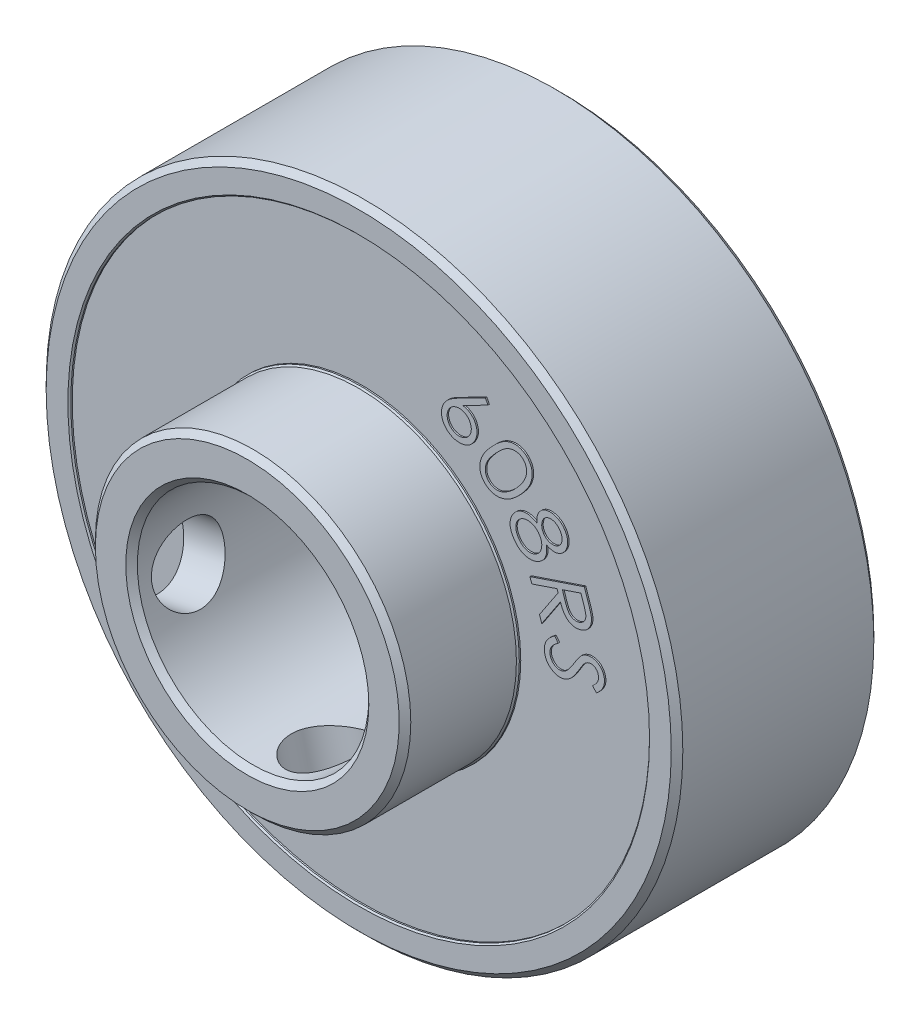
from build123d import *

# Parameters (mm, degrees)
SKETCH1_R                           = 11
SKETCH1_R_2                         = 4
BOSS_EXTRUDE1_DEPTH                 = 7
SKETCH2_R                           = 10
SKETCH2_R_2                         = 5.5
CUT_EXTRUDE1_DEPTH                  = 0.1
CUT_EXTRUDE2_START                  = -6.9
SKETCH2_2_R                         = 10
SKETCH2_2_R_2                       = 5.5
CUT_EXTRUDE2_DEPTH                  = 0.1
CHAMFER2_SIZE                       = 0.05
ESBO_O2_R                           = 5.45
ESBO_O2_R_2                         = 4
RESSALTO_EXTRUS_O1_DEPTH            = 3.85
BOSS_EXTRUDE2_DEPTH                 = 0.05
CHAMFER1_SIZE                       = 0.2
BOSS_EXTRUDE3_DEPTH                 = 0.05
FURO_ROSCADO_DE_M31_D               = 2.5
FURO_ROSCADO_DE_M31_DEPTH           = 7.5
FURO_ROSCADO_DE_M31_TIP             = 0.751075774
FURO_ROSCADO_DE_M31_ON_FACE_2_D     = 2.5
FURO_ROSCADO_DE_M31_ON_FACE_2_DEPTH = 7.5
FURO_ROSCADO_DE_M31_ON_FACE_2_TIP   = 0.751075774
SCALE1_SCALE                        = 1.25
SCALE2_SCALE                        = 1.5


with BuildPart() as part:
    # Sketch1 → Boss-Extrude1 (new body)
    with BuildSketch(Plane.XY):
        Circle(SKETCH1_R)
        Circle(SKETCH1_R_2, mode=Mode.SUBTRACT)
    extrude(amount=BOSS_EXTRUDE1_DEPTH)

    # Sketch2 → Cut-Extrude1 (cut)
    with BuildSketch(Plane.XY.offset(7)):
        Circle(SKETCH2_R)
        Circle(SKETCH2_R_2, mode=Mode.SUBTRACT)
    extrude(amount=-CUT_EXTRUDE1_DEPTH, mode=Mode.SUBTRACT)

    # Sketch2<2> → Cut-Extrude2 (cut)
    with BuildSketch(Plane.XY.offset(7).offset(CUT_EXTRUDE2_START)):
        Circle(SKETCH2_2_R)
        Circle(SKETCH2_2_R_2, mode=Mode.SUBTRACT)
    extrude(amount=-CUT_EXTRUDE2_DEPTH, mode=Mode.SUBTRACT)

    # Chamfer2
    chamfer2_edges = [part.edges().sort_by_distance(p)[0] for p in [
        (-5.5, 0, 7),
        (-10, 0, 7),
        (-10, 0, 0),
        (-5.5, 0, 0),
    ]]
    chamfer(chamfer2_edges, length=CHAMFER2_SIZE)

    # Esboço2 → Ressalto-extrusão1 (add)
    with BuildSketch(Plane.XY.offset(7)):
        Circle(ESBO_O2_R)
        Circle(ESBO_O2_R_2, mode=Mode.SUBTRACT)
    extrude(amount=RESSALTO_EXTRUS_O1_DEPTH)

    # Sketch3 → Boss-Extrude2 (add)
    # profile 1 of 5: a face of its own
    with BuildSketch(Plane(origin=(0, 0, 0.1), x_dir=(-1, 0, 0), z_dir=(0, 0, -1))):
        with BuildLine():
            Line((6.723953336, 1.374086402), (6.841741797, 1.216634479))
            add(Edge.make_bspline(
                [(6.841741797, 1.216634479), (6.817573288, 1.199359859), (6.771292818, 1.166280551), (6.7089583, 1.113159264), (6.65797847, 1.058354359), (6.616042027, 1.003718422), (6.585197602, 0.947642508), (6.564677897, 0.890789262), (6.554264641, 0.832905218), (6.556279326, 0.794387119), (6.557286669, 0.775128069)],
                knots=[0, 0, 0, 0, 1.292055059, 2.474166467, 3.555169481, 4.54276915, 5.463097752, 6.326728609, 7.163364304, 8, 8, 8, 8], degree=3))
            add(Edge.make_bspline(
                [(6.557286669, 0.775128069), (6.559589482, 0.75889953), (6.564156821, 0.726712276), (6.577499183, 0.679747808), (6.597073867, 0.635157474), (6.621192779, 0.592867963), (6.650084971, 0.554531373), (6.683420565, 0.521824686), (6.71962411, 0.494193194), (6.759139635, 0.472574946), (6.800541147, 0.456589651), (6.843001787, 0.446611622), (6.8860034, 0.441689172), (6.914655203, 0.443624683), (6.929081541, 0.444599223)],
                knots=[0, 0, 0, 0, 1.065647424, 2.113576877, 3.164384275, 4.227051853, 5.274981306, 6.276492859, 7.256630379, 8.228879028, 9.197081163, 10.13494145, 11.060932943, 12, 12, 12, 12], degree=3))
            add(Edge.make_bspline(
                [(6.929081541, 0.444599223), (6.945519436, 0.447087772), (6.978756008, 0.45211949), (7.026704444, 0.470689174), (7.073741901, 0.496394668), (7.101970562, 0.519552155), (7.116581541, 0.531538325)],
                knots=[0, 0, 0, 0, 0.947990027, 1.916786729, 2.921741833, 4, 4, 4, 4], degree=3))
            add(Edge.make_bspline(
                [(7.116581541, 0.531538325), (7.127135431, 0.541011836), (7.149222449, 0.560837855), (7.181222658, 0.595056366), (7.214764351, 0.633812728), (7.249572833, 0.677474782), (7.285307224, 0.726179014), (7.3219168, 0.780016687), (7.360652209, 0.838318589), (7.38569458, 0.879600754), (7.398632823, 0.900929351)],
                knots=[0, 0, 0, 0, 0.729441018, 1.526562937, 2.408317325, 3.366672661, 4.398852945, 5.515801495, 6.716528806, 8, 8, 8, 8], degree=3))
            add(Edge.make_bspline(
                [(7.398632823, 0.900929351), (7.411481182, 0.922096096), (7.436017587, 0.962518055), (7.472820572, 1.019379999), (7.50609449, 1.07074534), (7.537338687, 1.115557702), (7.565826722, 1.154147196), (7.591394823, 1.186795914), (7.614407064, 1.213420818), (7.629713327, 1.228338761), (7.636613592, 1.235063966)],
                knots=[0, 0, 0, 0, 1.445236574, 2.759956344, 3.953419532, 5.017350228, 5.948124348, 6.752849745, 7.43776821, 8, 8, 8, 8], degree=3))
            add(Edge.make_bspline(
                [(7.636613592, 1.235063966), (7.647453442, 1.244543907), (7.668850152, 1.263256302), (7.702463752, 1.288692966), (7.737555465, 1.310371795), (7.773613033, 1.328839241), (7.810780176, 1.344090457), (7.848714771, 1.356654507), (7.887907457, 1.365581106), (7.91448874, 1.368839266), (7.927879618, 1.370480633)],
                knots=[0, 0, 0, 0, 1.056756624, 2.085925105, 3.08957304, 4.080262677, 5.055903979, 6.035378084, 7.010280581, 8, 8, 8, 8], degree=3))
            add(Edge.make_bspline(
                [(7.927879618, 1.370480633), (7.948981269, 1.371870248), (7.990587385, 1.37461015), (8.052279005, 1.368496586), (8.111981804, 1.355515205), (8.168798048, 1.333504491), (8.222511066, 1.304967414), (8.271642008, 1.26880591), (8.315398275, 1.225611054), (8.35382237, 1.176261797), (8.385992991, 1.122092785), (8.41166226, 1.064244335), (8.429536588, 1.002885194), (8.435353033, 0.960458902), (8.438296284, 0.938990248)],
                knots=[0, 0, 0, 0, 1.01991207, 2.010960161, 2.982781706, 3.962746851, 4.943984954, 5.912890685, 6.898148972, 7.904611514, 8.925685622, 9.933656005, 10.954383679, 12, 12, 12, 12], degree=3))
            add(Edge.make_bspline(
                [(8.438296284, 0.938990248), (8.439905173, 0.916018968), (8.443100643, 0.870394895), (8.435954309, 0.802226976), (8.421251944, 0.735375989), (8.401131857, 0.681031699), (8.37977872, 0.638088379), (8.360564, 0.604548729), (8.337040201, 0.570775496), (8.310670734, 0.53558058), (8.279863744, 0.500254418), (8.246489716, 0.463106616), (8.208609747, 0.426121993), (8.181946924, 0.401530075), (8.168264233, 0.38891012)],
                knots=[0, 0, 0, 0, 1.294867467, 2.571782184, 3.843746611, 5.143215914, 5.822746795, 6.543964101, 7.318006915, 8.13942962, 9.019769218, 9.956863672, 10.951513765, 12, 12, 12, 12], degree=3))
            Line((8.168264233, 0.38891012), (8.029642438, 0.537547941))
            add(Edge.make_bspline(
                [(8.029642438, 0.537547941), (8.040491364, 0.547797716), (8.061430909, 0.567580842), (8.091198861, 0.596726402), (8.1177117, 0.624750316), (8.140998798, 0.651703899), (8.161430413, 0.677149832), (8.178807729, 0.701361339), (8.193307277, 0.724006553), (8.208313949, 0.752376209), (8.222111687, 0.78797107), (8.232490263, 0.831773931), (8.237254627, 0.876823898), (8.235338696, 0.906937777), (8.234370002, 0.922163325)],
                knots=[0, 0, 0, 0, 1.182699611, 2.282732375, 3.300866298, 4.238668036, 5.104698929, 5.88587987, 6.599324344, 7.233663973, 8.426546453, 9.612413994, 10.792838817, 12, 12, 12, 12], degree=3))
            add(Edge.make_bspline(
                [(8.234370002, 0.922163325), (8.231544844, 0.941132772), (8.226095153, 0.97772457), (8.207511221, 1.029103552), (8.179226125, 1.07342249), (8.143481188, 1.110786437), (8.101919482, 1.139998909), (8.056290048, 1.160326247), (8.006902954, 1.169811767), (7.973443836, 1.168186943), (7.956325131, 1.167355633)],
                knots=[0, 0, 0, 0, 1.109513479, 2.140235993, 3.138523126, 4.134648421, 5.117916045, 6.063936821, 7.00945106, 8, 8, 8, 8], degree=3))
            add(Edge.make_bspline(
                [(7.956325131, 1.167355633), (7.945745182, 1.165793238), (7.92452439, 1.162659454), (7.893216116, 1.154810012), (7.863019919, 1.142853978), (7.833191485, 1.128051735), (7.803915641, 1.108026169), (7.773495168, 1.083650001), (7.743435661, 1.052289809), (7.723571823, 1.029230065), (7.713136028, 1.017115248)],
                knots=[0, 0, 0, 0, 0.872627401, 1.750277355, 2.626708255, 3.518723759, 4.461878059, 5.515567722, 6.694762481, 8, 8, 8, 8], degree=3))
            add(Edge.make_bspline(
                [(7.713136028, 1.017115248), (7.709759885, 1.012601252), (7.701657657, 1.00176835), (7.688608104, 0.982001066), (7.672276268, 0.956433232), (7.65262288, 0.924978085), (7.629276842, 0.887948617), (7.60342511, 0.84439932), (7.573757222, 0.795347482), (7.552995234, 0.760582288), (7.54206231, 0.742275505)],
                knots=[0, 0, 0, 0, 0.417704147, 1.002426291, 1.754721007, 2.666443671, 3.751275867, 4.998903859, 6.419671761, 8, 8, 8, 8], degree=3))
            add(Edge.make_bspline(
                [(7.54206231, 0.742275505), (7.528720878, 0.72014766), (7.502869753, 0.677271475), (7.462909444, 0.616494005), (7.424908705, 0.560118495), (7.386533341, 0.509633022), (7.349495907, 0.463846731), (7.313037636, 0.423278472), (7.277439614, 0.387815365), (7.231706317, 0.348414155), (7.174122265, 0.307697522), (7.102778014, 0.269865497), (7.029575045, 0.243643782), (6.979473401, 0.23602383), (6.954722566, 0.232259479)],
                knots=[0, 0, 0, 0, 1.151589416, 2.231385892, 3.241866087, 4.181198595, 5.056967968, 5.86622306, 6.611257172, 7.295010099, 8.555133183, 9.745337415, 10.8861687, 12, 12, 12, 12], degree=3))
            add(Edge.make_bspline(
                [(6.954722566, 0.232259479), (6.937104145, 0.230954156), (6.902273291, 0.228373588), (6.850287945, 0.230996996), (6.799553841, 0.238604602), (6.7498888, 0.251362609), (6.70178582, 0.270191913), (6.654518449, 0.293243368), (6.609132064, 0.322693373), (6.565113537, 0.35621304), (6.524107945, 0.393956855), (6.487534332, 0.434933646), (6.45562657, 0.478557564), (6.428202178, 0.524760922), (6.405676349, 0.573922386), (6.388114701, 0.625763552), (6.37509852, 0.680239147), (6.370249322, 0.717645223), (6.367783464, 0.73666653)],
                knots=[0, 0, 0, 0, 0.985637329, 1.948562123, 2.898699275, 3.846375535, 4.804641011, 5.778360361, 6.777444169, 7.819911255, 8.864722404, 9.88397061, 10.881717925, 11.877903731, 12.878850076, 13.895148367, 14.929665032, 16, 16, 16, 16], degree=3))
            add(Edge.make_bspline(
                [(6.367783464, 0.73666653), (6.366427586, 0.751479961), (6.36374365, 0.780802889), (6.364781078, 0.824712107), (6.366958187, 0.867892434), (6.373888092, 0.910243045), (6.38267062, 0.952061727), (6.395985544, 0.99277455), (6.410879198, 1.033227048), (6.430041569, 1.072638466), (6.452506534, 1.111705681), (6.479103013, 1.150236727), (6.509821859, 1.188344837), (6.544257517, 1.226550474), (6.583270723, 1.264064543), (6.626226549, 1.301327262), (6.673295047, 1.338362343), (6.706747289, 1.361952754), (6.723953336, 1.374086402)],
                knots=[0, 0, 0, 0, 0.924783812, 1.830593555, 2.729938474, 3.612542721, 4.497647048, 5.385983185, 6.274940971, 7.178116819, 8.108855036, 9.07694148, 10.087910257, 11.152769032, 12.275211649, 13.45327497, 14.690100631, 16, 16, 16, 16], degree=3))
        make_face()
    # profile 2 of 5: a face of its own
    with BuildSketch(Plane(origin=(0, 0, 0.1), x_dir=(-1, 0, 0), z_dir=(0, 0, -1))):
        with BuildLine():
            Line((7.746137114, 3.357649879), (7.872739678, 2.983451161))
            add(Edge.make_bspline(
                [(7.872739678, 2.983451161), (7.881059185, 2.958357449), (7.896967784, 2.910373143), (7.919192418, 2.841249827), (7.93827157, 2.778162874), (7.954988951, 2.721116942), (7.968277975, 2.670083531), (7.97810167, 2.624967975), (7.986304921, 2.586220173), (7.989206196, 2.562134117), (7.99052814, 2.551159494)],
                knots=[0, 0, 0, 0, 1.41401025, 2.703876705, 3.883389485, 4.939117467, 5.883308228, 6.703003456, 7.409033675, 8, 8, 8, 8], degree=3))
            add(Edge.make_bspline(
                [(7.99052814, 2.551159494), (7.991680371, 2.536346044), (7.993961878, 2.507014281), (7.99355178, 2.463189389), (7.989536296, 2.420458725), (7.982244147, 2.378807362), (7.971867446, 2.338150413), (7.957859366, 2.298427821), (7.940049121, 2.259949253), (7.919392559, 2.222682043), (7.895267023, 2.187520322), (7.868522083, 2.15435442), (7.838146422, 2.124526727), (7.805654899, 2.096319063), (7.769505392, 2.071821996), (7.730676725, 2.049581161), (7.689074117, 2.029824145), (7.65969703, 2.019263938), (7.644774935, 2.013899879)],
                knots=[0, 0, 0, 0, 1.027353843, 2.034239082, 3.026914782, 3.992754084, 4.956116645, 5.926055136, 6.901519887, 7.885736109, 8.869562139, 9.847691085, 10.827432488, 11.810304063, 12.819812835, 13.841795782, 14.903739854, 16, 16, 16, 16], degree=3))
            add(Edge.make_bspline(
                [(7.644774935, 2.013899879), (7.619571721, 2.006225956), (7.570483848, 1.991279587), (7.495245456, 1.981482942), (7.421726968, 1.981550073), (7.350113043, 1.99285135), (7.28164526, 2.01459628), (7.217050526, 2.046407449), (7.157909987, 2.089546729), (7.111856988, 2.132170274), (7.078246075, 2.172604827), (7.052872874, 2.206693439), (7.028502864, 2.24470871), (7.00542963, 2.286885007), (6.981948203, 2.332291093), (6.960215509, 2.382102891), (6.938952909, 2.435460163), (6.925647847, 2.472458787), (6.918813396, 2.491463981)],
                knots=[0, 0, 0, 0, 1.278263464, 2.489652168, 3.670679834, 4.839936614, 5.997393751, 7.149490657, 8.321732671, 9.542815408, 10.187555536, 10.874109659, 11.606713321, 12.379429923, 13.209421677, 14.089665205, 15.018712606, 16, 16, 16, 16], degree=3))
            Line((6.918813396, 2.491463981), (6.274181986, 1.519909494))
            Line((6.274181986, 1.519909494), (6.195656345, 1.75268193))
            Line((6.195656345, 1.75268193), (6.840688396, 2.722633853))
            Line((6.840688396, 2.722633853), (6.804630704, 2.829605007))
            Line((6.804630704, 2.829605007), (5.931233268, 2.53393193))
            Line((5.931233268, 2.53393193), (5.867531345, 2.721832571))
            Line((5.867531345, 2.721832571), (7.746137114, 3.357649879))
        make_face()
        with BuildLine():
            Line((7.625944806, 3.107649879), (6.987323011, 2.891303725))
            Line((6.987323011, 2.891303725), (7.093893524, 2.567585776))
            add(Edge.make_bspline(
                [(7.093893524, 2.567585776), (7.099141602, 2.552460366), (7.109268083, 2.523274973), (7.12546665, 2.481526975), (7.141165795, 2.442969417), (7.157905934, 2.408224542), (7.173577508, 2.37635315), (7.19005439, 2.34833638), (7.206517147, 2.323717963), (7.228098548, 2.295648952), (7.257158343, 2.265709238), (7.296463649, 2.236869944), (7.338965987, 2.214103265), (7.38510297, 2.199047445), (7.432884658, 2.190547052), (7.481570808, 2.189590563), (7.530612026, 2.194710922), (7.562229046, 2.204464605), (7.578268524, 2.209412699)],
                knots=[0, 0, 0, 0, 1.118554581, 2.158318542, 3.128777667, 4.026236993, 4.852521549, 5.609511046, 6.2953485, 6.920617761, 8.081985124, 9.196171859, 10.314843201, 11.436157874, 12.572935431, 13.69304583, 14.829670183, 16, 16, 16, 16], degree=3))
            add(Edge.make_bspline(
                [(7.578268524, 2.209412699), (7.59342902, 2.215251964), (7.62342383, 2.226804859), (7.664579795, 2.251684726), (7.701464878, 2.282014563), (7.733367565, 2.317620085), (7.759719917, 2.357194019), (7.780045409, 2.399320856), (7.793065142, 2.44385535), (7.798012121, 2.482767203), (7.798617957, 2.516069958), (7.796430694, 2.544330853), (7.791830588, 2.575579595), (7.785411015, 2.609926292), (7.776957572, 2.647370858), (7.766058218, 2.687842945), (7.752740917, 2.731460489), (7.742856393, 2.761514748), (7.737723652, 2.777121033)],
                knots=[0, 0, 0, 0, 1.157480747, 2.290057996, 3.413820966, 4.554229024, 5.688088466, 6.796349954, 7.878911532, 8.984095935, 9.584534887, 10.253304793, 11.003966908, 11.837573395, 12.74613744, 13.742422656, 14.827707137, 16, 16, 16, 16], degree=3))
            Line((7.737723652, 2.777121033), (7.625944806, 3.107649879))
        make_face(mode=Mode.SUBTRACT)
    # profile 3 of 5: a face of its own
    with BuildSketch(Plane(origin=(0, 0, 0.1), x_dir=(-1, 0, 0), z_dir=(0, 0, -1))):
        with BuildLine():
            add(Edge.make_bspline(
                [(6.436645373, 3.958851709), (6.438849744, 3.940573746), (6.443153326, 3.904889774), (6.446080097, 3.852458084), (6.447345332, 3.802571834), (6.444615596, 3.755237655), (6.440242818, 3.710182835), (6.431945321, 3.667690701), (6.421801836, 3.627540907), (6.408467872, 3.589869698), (6.392118978, 3.554645749), (6.374421381, 3.520656156), (6.353059749, 3.489126668), (6.330588283, 3.458332588), (6.304473045, 3.429986163), (6.276658623, 3.402650225), (6.246016539, 3.377299569), (6.224148017, 3.36201487), (6.213087681, 3.354284402)],
                knots=[0, 0, 0, 0, 1.290890309, 2.520198396, 3.681805585, 4.788490099, 5.843551436, 6.853927339, 7.821726867, 8.74603337, 9.651448064, 10.544029729, 11.429902383, 12.319727641, 13.215057227, 14.129151139, 15.053789794, 16, 16, 16, 16], degree=3))
            add(Edge.make_bspline(
                [(6.213087681, 3.354284402), (6.197080539, 3.344144505), (6.165376402, 3.324061175), (6.115609733, 3.298721518), (6.064443052, 3.278646051), (6.012154311, 3.263322512), (5.958510855, 3.252871046), (5.903673026, 3.247212262), (5.847609117, 3.246868388), (5.810160039, 3.250090216), (5.791212681, 3.251720299)],
                knots=[0, 0, 0, 0, 1.02459754, 2.029343036, 3.015319328, 3.993724459, 4.972689464, 5.967517749, 6.971665777, 8, 8, 8, 8], degree=3))
            add(Edge.make_bspline(
                [(5.791212681, 3.251720299), (5.76812279, 3.255152686), (5.722105673, 3.26199328), (5.655371216, 3.282467937), (5.591465368, 3.310695655), (5.530691013, 3.347287029), (5.472409223, 3.391028314), (5.417139616, 3.44291569), (5.364964002, 3.502778785), (5.333693598, 3.547097948), (5.317654988, 3.569829274)],
                knots=[0, 0, 0, 0, 0.94927729, 1.891867025, 2.831441269, 3.787189233, 4.773456595, 5.792841766, 6.867947176, 8, 8, 8, 8], degree=3))
            add(Edge.make_bspline(
                [(5.317654988, 3.569829274), (5.303063571, 3.592276258), (5.274661246, 3.635969511), (5.240442419, 3.70396576), (5.213126694, 3.770723532), (5.193673612, 3.836759996), (5.18189304, 3.902041339), (5.177652501, 3.9664582), (5.181746591, 4.030123994), (5.193666901, 4.092147537), (5.210811163, 4.152011519), (5.232533781, 4.208453206), (5.257704373, 4.261497857), (5.287473484, 4.310315858), (5.320899663, 4.355598373), (5.358263051, 4.396995678), (5.399718813, 4.434649249), (5.43013903, 4.456340746), (5.445459476, 4.467265171)],
                knots=[0, 0, 0, 0, 1.265189782, 2.462703114, 3.593198436, 4.67234407, 5.711673085, 6.724080211, 7.71757927, 8.719632106, 9.70506986, 10.658584755, 11.576575664, 12.477685061, 13.358041525, 14.234425087, 15.110808649, 16, 16, 16, 16], degree=3))
            add(Edge.make_bspline(
                [(5.445459476, 4.467265171), (5.456987966, 4.474624406), (5.480000329, 4.489314395), (5.515649837, 4.508441139), (5.552366299, 4.524126629), (5.589327481, 4.537519912), (5.627481553, 4.547343512), (5.665928122, 4.555312832), (5.705401353, 4.558925918), (5.745399858, 4.560814177), (5.786673455, 4.559096182), (5.829078302, 4.554049573), (5.872697014, 4.544281293), (5.91778122, 4.532182679), (5.964098431, 4.515785424), (6.011833619, 4.496274612), (6.060588671, 4.472457347), (6.093098017, 4.454707355), (6.109722296, 4.445630556)],
                knots=[0, 0, 0, 0, 0.931334836, 1.859065266, 2.751202648, 3.648748233, 4.533436264, 5.43245535, 6.319384756, 7.229651734, 8.158095254, 9.129430785, 10.133761898, 11.19951572, 12.306952597, 13.477470392, 14.710056011, 16, 16, 16, 16], degree=3))
            add(Edge.make_bspline(
                [(6.109722296, 4.445630556), (6.107482301, 4.47205299), (6.10313889, 4.52328682), (6.107287375, 4.598282233), (6.11985051, 4.668288878), (6.14164351, 4.732865757), (6.171434346, 4.791786736), (6.208476731, 4.844446438), (6.252045054, 4.891203726), (6.28610488, 4.91622277), (6.303231911, 4.928803633)],
                knots=[0, 0, 0, 0, 1.159116483, 2.247558892, 3.275615725, 4.262372356, 5.218835671, 6.154236364, 7.07185513, 8, 8, 8, 8], degree=3))
            add(Edge.make_bspline(
                [(6.303231911, 4.928803633), (6.321754889, 4.940084937), (6.359014229, 4.962777505), (6.421256217, 4.986222737), (6.488036273, 5.000993457), (6.558445944, 5.007117844), (6.630670913, 5.005090507), (6.702669609, 4.992413163), (6.77329377, 4.969774079), (6.841463499, 4.937151075), (6.906181416, 4.896456921), (6.965941656, 4.848096386), (7.019799943, 4.792057066), (7.050247347, 4.749841495), (7.065651783, 4.72848312)],
                knots=[0, 0, 0, 0, 0.892779067, 1.795842916, 2.727080536, 3.70581188, 4.703144711, 5.698163754, 6.710047702, 7.752069251, 8.806330382, 9.855631886, 10.91508709, 12, 12, 12, 12], degree=3))
            add(Edge.make_bspline(
                [(7.065651783, 4.72848312), (7.079336383, 4.706774175), (7.106401224, 4.663839111), (7.136261198, 4.594226894), (7.157475004, 4.522286133), (7.168858659, 4.44845505), (7.171401759, 4.374581199), (7.164611604, 4.302250625), (7.148558493, 4.232231558), (7.122885922, 4.165630452), (7.089294662, 4.103906053), (7.0495902, 4.047721731), (7.002341174, 3.999113654), (6.966283703, 3.972535032), (6.948263963, 3.95925235)],
                knots=[0, 0, 0, 0, 1.068771019, 2.113771646, 3.146516798, 4.18939315, 5.220229497, 6.221594843, 7.210477599, 8.206485729, 9.188317762, 10.134173663, 11.067552274, 12, 12, 12, 12], degree=3))
            add(Edge.make_bspline(
                [(6.948263963, 3.95925235), (6.92948131, 3.947579211), (6.892704816, 3.924723167), (6.832726752, 3.900840341), (6.770949722, 3.886814804), (6.707208907, 3.88185386), (6.641795956, 3.887028294), (6.57452711, 3.90142974), (6.505301459, 3.925243395), (6.460060234, 3.947389739), (6.436645373, 3.958851709)],
                knots=[0, 0, 0, 0, 0.981875121, 1.922514633, 2.854567088, 3.789622669, 4.754286786, 5.76174218, 6.841576559, 8, 8, 8, 8], degree=3))
        make_face()
        with BuildLine():
            add(Edge.make_bspline(
                [(6.899786399, 4.627521581), (6.89206632, 4.638457323), (6.87685916, 4.659998761), (6.851731015, 4.689696603), (6.824543522, 4.715861262), (6.79632334, 4.739189166), (6.766173857, 4.759065259), (6.734647119, 4.775820377), (6.701543011, 4.789622008), (6.667263629, 4.799834203), (6.632827413, 4.807110393), (6.598864764, 4.810677554), (6.565845271, 4.811257308), (6.533573133, 4.808043896), (6.502305027, 4.801150813), (6.471895114, 4.791090338), (6.442508709, 4.777396374), (6.423983999, 4.765933971), (6.414610117, 4.760133761)],
                knots=[0, 0, 0, 0, 1.147797877, 2.260954539, 3.330167184, 4.38025149, 5.396817843, 6.421610434, 7.438370352, 8.467442645, 9.485040915, 10.452679454, 11.391973248, 12.312859485, 13.227240642, 14.132754951, 15.055135845, 16, 16, 16, 16], degree=3))
            add(Edge.make_bspline(
                [(6.414610117, 4.760133761), (6.405774199, 4.753786345), (6.388108367, 4.741095827), (6.364373565, 4.718498267), (6.343734102, 4.693036444), (6.324762197, 4.66560438), (6.309508042, 4.635122756), (6.296405059, 4.602338894), (6.286620035, 4.566820361), (6.27902636, 4.529487679), (6.274755334, 4.491152689), (6.273205383, 4.453199531), (6.276275975, 4.416049243), (6.282273469, 4.379861769), (6.29134367, 4.344469632), (6.304515391, 4.310097751), (6.320673305, 4.276359421), (6.334378057, 4.255189882), (6.341292809, 4.244508761)],
                knots=[0, 0, 0, 0, 0.908844192, 1.81707094, 2.729132775, 3.645761934, 4.599514883, 5.571907187, 6.593318126, 7.675011067, 8.753876802, 9.815092739, 10.84525358, 11.863975947, 12.879511735, 13.893573417, 14.937199413, 16, 16, 16, 16], degree=3))
            add(Edge.make_bspline(
                [(6.341292809, 4.244508761), (6.350814274, 4.231255034), (6.369827412, 4.204789049), (6.404691636, 4.170598056), (6.443344082, 4.140394154), (6.485652106, 4.115036742), (6.53091205, 4.095367527), (6.577788532, 4.082025189), (6.625777609, 4.074990316), (6.673984131, 4.075405122), (6.721007008, 4.080627131), (6.765184168, 4.092077638), (6.806448491, 4.107815252), (6.831074035, 4.122859441), (6.843296014, 4.130326068)],
                knots=[0, 0, 0, 0, 1.029778083, 2.056334151, 3.072742447, 4.125103068, 5.164692881, 6.18264204, 7.197261409, 8.21856438, 9.221531217, 10.179595353, 11.096509409, 12, 12, 12, 12], degree=3))
            add(Edge.make_bspline(
                [(6.843296014, 4.130326068), (6.851446438, 4.13616324), (6.867594435, 4.147728114), (6.88939698, 4.168131937), (6.90904658, 4.190508833), (6.92640353, 4.215277105), (6.941639015, 4.242075679), (6.954455745, 4.271261696), (6.965288178, 4.302452796), (6.973600755, 4.335686204), (6.979511889, 4.370209731), (6.980683648, 4.405777115), (6.977172407, 4.441591107), (6.970465098, 4.478043747), (6.9591051, 4.514969221), (6.943248573, 4.552252268), (6.923519635, 4.590151684), (6.907856867, 4.614813977), (6.899786399, 4.627521581)],
                knots=[0, 0, 0, 0, 0.860567069, 1.704995385, 2.558804371, 3.415153889, 4.298967395, 5.203031682, 6.150124742, 7.132495547, 8.143595732, 9.153914339, 10.17923786, 11.230179396, 12.333615959, 13.490750709, 14.707072956, 16, 16, 16, 16], degree=3))
        make_face(mode=Mode.SUBTRACT)
        with BuildLine():
            add(Edge.make_bspline(
                [(6.192654988, 4.141544017), (6.183073031, 4.155401294), (6.164227572, 4.182655302), (6.131187317, 4.218933327), (6.097015473, 4.252070626), (6.059989677, 4.280785033), (6.020837675, 4.305788703), (5.978908288, 4.326108106), (5.934953683, 4.342757084), (5.889255118, 4.354794419), (5.843074833, 4.363522847), (5.797427161, 4.366805064), (5.753115121, 4.366894985), (5.710232395, 4.361231726), (5.668413788, 4.352462102), (5.628232574, 4.337906769), (5.58882321, 4.320171181), (5.564407056, 4.304523989), (5.552029988, 4.296592094)],
                knots=[0, 0, 0, 0, 1.103096915, 2.169532516, 3.209705979, 4.22005898, 5.235178716, 6.249127762, 7.268541052, 8.31114268, 9.343069619, 10.344088993, 11.307028603, 12.241865975, 13.174241085, 14.101672058, 15.037697202, 16, 16, 16, 16], degree=3))
            add(Edge.make_bspline(
                [(5.552029988, 4.296592094), (5.53739373, 4.285920167), (5.508158373, 4.264603408), (5.470459325, 4.225147952), (5.438160928, 4.180583136), (5.411429753, 4.131524815), (5.391128257, 4.078821031), (5.379712135, 4.02334043), (5.375573245, 3.966204794), (5.379709706, 3.907692931), (5.391978104, 3.848519155), (5.411845955, 3.789219006), (5.439605058, 3.729865997), (5.463581076, 3.692173419), (5.475908194, 3.672794017)],
                knots=[0, 0, 0, 0, 0.926109246, 1.849867156, 2.780058085, 3.737943589, 4.703270699, 5.660960876, 6.627667837, 7.628486545, 8.654526651, 9.714225142, 10.824783286, 12, 12, 12, 12], degree=3))
            add(Edge.make_bspline(
                [(5.475908194, 3.672794017), (5.486060461, 3.658170197), (5.505883669, 3.629615884), (5.539352829, 3.591150094), (5.574498341, 3.557119283), (5.611193238, 3.52754691), (5.649610266, 3.502113814), (5.690285635, 3.482258235), (5.73254201, 3.466467844), (5.776087466, 3.455386323), (5.819965834, 3.44854851), (5.863310687, 3.446190652), (5.905570882, 3.447721693), (5.946649447, 3.453327605), (5.986515083, 3.463003588), (6.025261611, 3.476638949), (6.062787941, 3.494832298), (6.086485292, 3.509769369), (6.098504347, 3.517345299)],
                knots=[0, 0, 0, 0, 1.19035752, 2.32427924, 3.40484362, 4.459799014, 5.473418872, 6.48040078, 7.481219341, 8.486773131, 9.481309882, 10.447796045, 11.386669185, 12.306601008, 13.216804754, 14.126789189, 15.049926509, 16, 16, 16, 16], degree=3))
            add(Edge.make_bspline(
                [(6.098504347, 3.517345299), (6.109623379, 3.525413647), (6.131612455, 3.541369668), (6.161538623, 3.568937135), (6.18821179, 3.599437638), (6.210866349, 3.633334346), (6.230793072, 3.669716469), (6.247216973, 3.709047676), (6.259874558, 3.751393122), (6.269542145, 3.795841921), (6.274911413, 3.841443699), (6.276921551, 3.886781556), (6.273360853, 3.931306877), (6.266335015, 3.975088203), (6.254596548, 4.018173699), (6.238424813, 4.06039773), (6.21802423, 4.101939076), (6.201197342, 4.128208206), (6.192654988, 4.141544017)],
                knots=[0, 0, 0, 0, 0.942671861, 1.864234432, 2.78725575, 3.718123832, 4.657802721, 5.631928245, 6.638488188, 7.688830978, 8.751153965, 9.788000563, 10.799352584, 11.812407604, 12.828984143, 13.859322421, 14.913261601, 16, 16, 16, 16], degree=3))
        make_face(mode=Mode.SUBTRACT)
    # profile 4 of 5: a face of its own
    with BuildSketch(Plane(origin=(0, 0, 0.1), x_dir=(-1, 0, 0), z_dir=(0, 0, -1))):
        with BuildLine():
            add(Edge.make_bspline(
                [(4.543033426, 5.949335529), (4.564943157, 5.972693181), (4.607527355, 6.018091587), (4.67157506, 6.0821776), (4.733665606, 6.140505217), (4.794137626, 6.192741517), (4.85293655, 6.238729797), (4.909649751, 6.279135227), (4.964441144, 6.313866459), (5.018164906, 6.342452083), (5.070566701, 6.366205448), (5.122024451, 6.38603643), (5.172895525, 6.401712181), (5.223134838, 6.413290127), (5.272621026, 6.421532789), (5.321665929, 6.425568094), (5.370160168, 6.42549656), (5.417968316, 6.42189385), (5.464631842, 6.414853045), (5.509827437, 6.403785557), (5.553710443, 6.389848585), (5.596047144, 6.372253298), (5.636808987, 6.351171515), (5.676066811, 6.327121226), (5.714074787, 6.299926787), (5.737519741, 6.279144916), (5.749363554, 6.268646427)],
                knots=[0, 0, 0, 0, 1.642537938, 3.192470103, 4.646338539, 6.011168142, 7.289605298, 8.473669563, 9.581665276, 10.614373007, 11.59226402, 12.531086133, 13.441104306, 14.320069679, 15.173659948, 16.012137794, 16.84096325, 17.65841702, 18.469272155, 19.258427056, 20.042601694, 20.82874835, 21.606886513, 22.39398752, 23.188682081, 24, 24, 24, 24], degree=3))
            add(Edge.make_bspline(
                [(5.749363554, 6.268646427), (5.760911716, 6.257617316), (5.783832443, 6.2357268), (5.814606127, 6.199685182), (5.842763625, 6.162273296), (5.86720813, 6.122744115), (5.888632845, 6.081687155), (5.906688759, 6.038659944), (5.921436917, 5.993756214), (5.933125957, 5.947322605), (5.941123235, 5.899359884), (5.945576238, 5.850210478), (5.945937318, 5.799696325), (5.942178582, 5.748167993), (5.934948076, 5.695283356), (5.923723996, 5.64133292), (5.908257359, 5.586132596), (5.889035669, 5.529625786), (5.865374627, 5.471491833), (5.83582998, 5.412255968), (5.80126516, 5.351314775), (5.761491532, 5.288687708), (5.716170301, 5.224741752), (5.665349958, 5.159251463), (5.609380215, 5.092013278), (5.569231642, 5.047489171), (5.5486424, 5.024656042)],
                knots=[0, 0, 0, 0, 0.812736739, 1.613115341, 2.410193159, 3.195255584, 3.977011722, 4.766451224, 5.568648116, 6.381840011, 7.202505524, 8.042362829, 8.892510741, 9.771967907, 10.671265438, 11.608935862, 12.575845681, 13.588824347, 14.647177854, 15.769502049, 16.957239641, 18.213799721, 19.545973321, 20.947120805, 22.434403522, 24, 24, 24, 24], degree=3))
            add(Edge.make_bspline(
                [(5.5486424, 5.024656042), (5.527680493, 5.002353903), (5.486797486, 4.958856979), (5.424765374, 4.897538301), (5.363751907, 4.841756827), (5.304193874, 4.791136914), (5.245683972, 4.746127832), (5.188196251, 4.706632475), (5.131917607, 4.672564327), (5.076622511, 4.643827313), (5.022302089, 4.620150633), (4.968866404, 4.60056073), (4.916443523, 4.584153257), (4.864386266, 4.572744454), (4.813189003, 4.564345172), (4.762509713, 4.561020629), (4.712689965, 4.560768112), (4.663807528, 4.564917701), (4.616099552, 4.572413487), (4.569931105, 4.58374163), (4.525340014, 4.598193132), (4.482211508, 4.615751886), (4.440882307, 4.637302377), (4.400706003, 4.661523567), (4.362510463, 4.689746565), (4.338690087, 4.710774866), (4.326687272, 4.721370786)],
                knots=[0, 0, 0, 0, 1.559433233, 3.041436978, 4.443008781, 5.770818333, 7.022943957, 8.202580838, 9.32288808, 10.372875569, 11.375398524, 12.339881119, 13.271916542, 14.171621232, 15.053181812, 15.912749435, 16.756523382, 17.589472185, 18.409479342, 19.214872608, 20.008917662, 20.796169375, 21.584390954, 22.381462505, 23.184437513, 24, 24, 24, 24], degree=3))
            add(Edge.make_bspline(
                [(4.326687272, 4.721370786), (4.315260387, 4.732257291), (4.292582092, 4.753863126), (4.262524999, 4.789474989), (4.234216651, 4.825811541), (4.210591491, 4.864827354), (4.189388006, 4.905106752), (4.171852571, 4.947252998), (4.157409917, 4.991049596), (4.146081336, 5.036416821), (4.1385724, 5.083328133), (4.134475716, 5.131406743), (4.134526669, 5.180589449), (4.138668218, 5.230653261), (4.146378676, 5.281762522), (4.157589801, 5.333992266), (4.172890384, 5.387243797), (4.192316993, 5.44187928), (4.216511887, 5.49808747), (4.245828348, 5.556425299), (4.281385112, 5.616628969), (4.322888369, 5.67887757), (4.369244831, 5.744006213), (4.421956893, 5.810719564), (4.480129534, 5.879757147), (4.521656172, 5.925690016), (4.543033426, 5.949335529)],
                knots=[0, 0, 0, 0, 0.809667474, 1.606901415, 2.389915423, 3.171938179, 3.944739181, 4.725317868, 5.512374, 6.310580304, 7.123290289, 7.948912628, 8.785395908, 9.645186643, 10.525642855, 11.437417869, 12.385812245, 13.368196359, 14.41253519, 15.525600646, 16.717987141, 17.999697683, 19.365829755, 20.821103961, 22.363554732, 24, 24, 24, 24], degree=3))
        make_face()
        with BuildLine():
            add(Edge.make_bspline(
                [(4.679251375, 5.818325914), (4.660851677, 5.798119355), (4.625169821, 5.75893352), (4.575066406, 5.700527005), (4.530060028, 5.644381866), (4.490109119, 5.590608243), (4.454150268, 5.539934716), (4.423546398, 5.49144367), (4.398220443, 5.445165553), (4.377241144, 5.40129025), (4.35988931, 5.359114478), (4.347091963, 5.31763911), (4.335718979, 5.277328241), (4.328855361, 5.237439496), (4.323935339, 5.198395489), (4.323658489, 5.159929724), (4.324705927, 5.122099941), (4.332062828, 5.073644615), (4.346039936, 5.016229297), (4.372941953, 4.953168665), (4.40806014, 4.896592751), (4.438775126, 4.865487268), (4.454091118, 4.849976555)],
                knots=[0, 0, 0, 0, 1.475488141, 2.861359785, 4.154121984, 5.359730204, 6.477947551, 7.508249804, 8.453740252, 9.324547233, 10.133287385, 10.913161477, 11.667000762, 12.392548848, 13.096455606, 13.788819075, 14.467224618, 15.137185669, 16.431314552, 17.646052312, 18.826206712, 20, 20, 20, 20], degree=3))
            add(Edge.make_bspline(
                [(4.454091118, 4.849976555), (4.470998304, 4.835844543), (4.504676122, 4.807694658), (4.563731671, 4.776736661), (4.628146618, 4.755513764), (4.685580759, 4.74573126), (4.73346006, 4.743796713), (4.770607522, 4.744784191), (4.808256766, 4.749765726), (4.846476655, 4.7579731), (4.885356808, 4.768707571), (4.924789742, 4.782747964), (4.964461886, 4.800624278), (4.990744591, 4.814196805), (5.004171247, 4.821130401)],
                knots=[0, 0, 0, 0, 1.34190696, 2.672975875, 4.03914862, 5.469008549, 6.211498008, 6.961821166, 7.734266787, 8.525620103, 9.346360653, 10.194610762, 11.077707539, 12, 12, 12, 12], degree=3))
            add(Edge.make_bspline(
                [(5.004171247, 4.821130401), (5.020977638, 4.830421862), (5.055134219, 4.849305423), (5.105185594, 4.881764095), (5.155673749, 4.917150584), (5.205669506, 4.95682755), (5.256454512, 4.999267098), (5.306984725, 5.045647846), (5.35784608, 5.095550455), (5.390788359, 5.130831575), (5.407616759, 5.14885476)],
                knots=[0, 0, 0, 0, 0.882398032, 1.79334748, 2.740232888, 3.715191852, 4.725879822, 5.7816566, 6.866770249, 8, 8, 8, 8], degree=3))
            add(Edge.make_bspline(
                [(5.407616759, 5.14885476), (5.424180747, 5.167029522), (5.45658333, 5.202583114), (5.501733152, 5.256702416), (5.543098053, 5.309660342), (5.58077131, 5.361374876), (5.615025998, 5.411615164), (5.644765307, 5.461224488), (5.670823679, 5.509629921), (5.693361068, 5.556938809), (5.712272001, 5.603065203), (5.727612485, 5.647874505), (5.739126559, 5.691583045), (5.748400632, 5.733736142), (5.752834323, 5.774825331), (5.755220583, 5.814429798), (5.753676352, 5.852830865), (5.746508693, 5.901432573), (5.732173642, 5.958555869), (5.706135375, 6.021663456), (5.67073215, 6.07767327), (5.640308497, 6.108613984), (5.625164836, 6.124015016)],
                knots=[0, 0, 0, 0, 1.327465575, 2.596797036, 3.803974219, 4.954802096, 6.050653377, 7.085610932, 8.075932289, 9.017660852, 9.913387465, 10.766122373, 11.572387875, 12.35293663, 13.093430198, 13.800930815, 14.493692928, 15.163603914, 16.450647312, 17.662487793, 18.836481221, 20, 20, 20, 20], degree=3))
            add(Edge.make_bspline(
                [(5.625164836, 6.124015016), (5.608285103, 6.138200877), (5.574619324, 6.166493862), (5.514977812, 6.196712457), (5.450201973, 6.218295255), (5.392180613, 6.227466046), (5.343795213, 6.230492325), (5.306274605, 6.228545799), (5.268394949, 6.224194501), (5.229871713, 6.21704111), (5.190985821, 6.205984316), (5.151532352, 6.192011613), (5.111544201, 6.174986568), (5.070779705, 6.154839157), (5.028631981, 6.130550497), (4.984923072, 6.100987844), (4.939041603, 6.06649501), (4.89071745, 6.027165691), (4.840939904, 5.982142624), (4.788729648, 5.932288445), (4.734224356, 5.877502417), (4.697964293, 5.838469719), (4.679251375, 5.818325914)],
                knots=[0, 0, 0, 0, 1.186933895, 2.367280006, 3.582519422, 4.861472594, 5.525769364, 6.196917143, 6.886441279, 7.583575583, 8.309531112, 9.066613021, 9.841978912, 10.654534034, 11.520211795, 12.46606624, 13.501419929, 14.618477826, 15.828573167, 17.123883194, 18.515707565, 20, 20, 20, 20], degree=3))
        make_face(mode=Mode.SUBTRACT)
    # profile 5 of 5: a face of its own
    with BuildSketch(Plane(origin=(0, 0, 0.1), x_dir=(-1, 0, 0), z_dir=(0, 0, -1))):
        with BuildLine():
            Line((4.324964443, 7.302356675), (4.416310597, 7.130481675))
            Line((4.416310597, 7.130481675), (3.555733674, 6.680962444))
            add(Edge.make_bspline(
                [(3.555733674, 6.680962444), (3.573820412, 6.677343593), (3.609234202, 6.670257891), (3.660020503, 6.655631802), (3.706959766, 6.637037992), (3.736127944, 6.622159713), (3.750445212, 6.614856675)],
                knots=[0, 0, 0, 0, 1.071524611, 2.098042594, 3.06641979, 4, 4, 4, 4], degree=3))
            add(Edge.make_bspline(
                [(3.750445212, 6.614856675), (3.767080526, 6.605028081), (3.79973166, 6.585736909), (3.844667082, 6.551553291), (3.885064799, 6.513987171), (3.921262857, 6.472864589), (3.951945795, 6.427668961), (3.978773631, 6.379220739), (4.000582274, 6.327012973), (4.018191547, 6.272085969), (4.030461657, 6.21560422), (4.037588265, 6.158731496), (4.038082899, 6.102220894), (4.033932701, 6.045949965), (4.023286554, 5.990142073), (4.007124801, 5.934646585), (3.985547474, 5.879431036), (3.966999274, 5.843995875), (3.957576622, 5.825994495)],
                knots=[0, 0, 0, 0, 1.019907112, 2.001833211, 2.975106465, 3.930005657, 4.888753167, 5.854816606, 6.850530802, 7.872265815, 8.897525529, 9.899342728, 10.89405696, 11.877628612, 12.875140218, 13.888660536, 14.927420607, 16, 16, 16, 16], degree=3))
            add(Edge.make_bspline(
                [(3.957576622, 5.825994495), (3.943401003, 5.802045015), (3.915487215, 5.75488512), (3.862951089, 5.692675141), (3.804519394, 5.638220775), (3.739385216, 5.593013878), (3.669307026, 5.556735668), (3.594664605, 5.530879797), (3.516222355, 5.515258034), (3.435036911, 5.509786674), (3.353146288, 5.514458347), (3.272777466, 5.529881756), (3.194647085, 5.555414913), (3.145724036, 5.580276576), (3.121038161, 5.592821418)],
                knots=[0, 0, 0, 0, 1.033065496, 2.034251297, 3.014475546, 3.995102051, 4.972102283, 5.939302282, 6.921736905, 7.936931798, 8.956451458, 9.962291878, 10.971801474, 12, 12, 12, 12], degree=3))
            add(Edge.make_bspline(
                [(3.121038161, 5.592821418), (3.098026879, 5.606472481), (3.0524791, 5.633492949), (2.992288878, 5.684987892), (2.938815288, 5.742646167), (2.893091356, 5.807005676), (2.856848611, 5.877071666), (2.829822579, 5.95090171), (2.814390825, 6.028443749), (2.808805845, 6.108143214), (2.813547075, 6.188295134), (2.828636553, 6.266552303), (2.852811134, 6.342529378), (2.87690699, 6.389852952), (2.889067007, 6.41373488)],
                knots=[0, 0, 0, 0, 1.012372306, 2.003856587, 2.988821669, 3.987270143, 4.9855775, 5.970178416, 6.956819527, 7.971542281, 8.990660658, 9.990237353, 10.98576963, 12, 12, 12, 12], degree=3))
            add(Edge.make_bspline(
                [(2.889067007, 6.41373488), (2.899540358, 6.431325076), (2.920940833, 6.467267588), (2.960198132, 6.517770314), (3.004943495, 6.567060495), (3.056853524, 6.615148364), (3.117971201, 6.662922917), (3.190061184, 6.711153599), (3.273543427, 6.760845263), (3.334013557, 6.792508176), (3.365829827, 6.809167572)],
                knots=[0, 0, 0, 0, 0.780869162, 1.595570546, 2.436441551, 3.320231236, 4.29319985, 5.394687772, 6.629218754, 8, 8, 8, 8], degree=3))
            Line((3.365829827, 6.809167572), (4.324964443, 7.302356675))
        make_face()
        with BuildLine():
            add(Edge.make_bspline(
                [(3.625044571, 6.485850264), (3.61246774, 6.492363366), (3.587793416, 6.505141338), (3.549283998, 6.520055204), (3.510411292, 6.531042293), (3.47074979, 6.537397013), (3.430752873, 6.539819896), (3.390231954, 6.538126728), (3.349267971, 6.532580911), (3.30840025, 6.522524522), (3.268684526, 6.508902031), (3.230704875, 6.492745024), (3.195685684, 6.472411), (3.163091352, 6.449070139), (3.13272335, 6.422628438), (3.105710691, 6.392249296), (3.080338604, 6.359286415), (3.066163338, 6.335110707), (3.058938802, 6.322789367)],
                knots=[0, 0, 0, 0, 1.036538255, 2.033571136, 3.018249213, 3.98933273, 4.969044784, 5.947780153, 6.95464472, 7.991182975, 9.024116511, 10.027031361, 11.00835282, 11.982631912, 12.959655734, 13.949709709, 14.955053332, 16, 16, 16, 16], degree=3))
            add(Edge.make_bspline(
                [(3.058938802, 6.322789367), (3.052424832, 6.310212609), (3.039645159, 6.28553843), (3.024743633, 6.247027964), (3.013710803, 6.208159143), (3.007523505, 6.168474735), (3.004467656, 6.128522842), (3.006132907, 6.087928786), (3.012460373, 6.047110429), (3.02173914, 6.006096324), (3.035393603, 5.966315568), (3.05221016, 5.928670302), (3.071880169, 5.893304629), (3.095339468, 5.860838927), (3.121746631, 5.830604201), (3.151755643, 5.803329461), (3.184551656, 5.778180829), (3.208612752, 5.764176376), (3.220797776, 5.757084239)],
                knots=[0, 0, 0, 0, 1.037953187, 2.036347074, 3.022369291, 3.994778392, 4.976462996, 5.956534394, 6.96615164, 8.001838703, 9.036182251, 10.044421244, 11.022239489, 11.997848527, 12.976206041, 13.960378582, 14.967094555, 16, 16, 16, 16], degree=3))
            add(Edge.make_bspline(
                [(3.220797776, 5.757084239), (3.233377904, 5.750582598), (3.258058696, 5.737827114), (3.296488373, 5.722763061), (3.335498991, 5.712383777), (3.374971571, 5.706056766), (3.414930952, 5.70302077), (3.455396792, 5.704628759), (3.496203169, 5.71105302), (3.537088515, 5.720284736), (3.576879413, 5.733924196), (3.614591623, 5.750863843), (3.650196609, 5.770325323), (3.682745964, 5.793747685), (3.712577884, 5.820567455), (3.740297359, 5.850138565), (3.765381679, 5.883121331), (3.779402485, 5.907166762), (3.786502904, 5.919343854)],
                knots=[0, 0, 0, 0, 1.038237759, 2.036905372, 3.020616447, 3.993292149, 4.965474482, 5.955602401, 6.955806131, 7.991777144, 9.026404274, 10.034919693, 11.021552688, 11.997429205, 12.968722844, 13.959819387, 14.966811367, 16, 16, 16, 16], degree=3))
            add(Edge.make_bspline(
                [(3.786502904, 5.919343854), (3.793042375, 5.931909999), (3.805987221, 5.956784611), (3.820573205, 5.99569852), (3.831638485, 6.034937419), (3.838525134, 6.074539053), (3.840844134, 6.11470636), (3.839232802, 6.155095551), (3.833585246, 6.196048891), (3.823580038, 6.236788916), (3.809963735, 6.276508839), (3.793718376, 6.314578155), (3.773506953, 6.34968447), (3.750705692, 6.382621156), (3.72391794, 6.412312718), (3.694115201, 6.439628378), (3.661283282, 6.464747606), (3.637227105, 6.478756087), (3.625044571, 6.485850264)],
                knots=[0, 0, 0, 0, 1.036883605, 2.052505109, 3.037511257, 4.020182804, 4.990456222, 5.979292736, 6.976801729, 8.013685334, 9.04696302, 10.050212019, 11.040354247, 12.009295177, 12.979321976, 13.962480355, 14.968158935, 16, 16, 16, 16], degree=3))
        make_face(mode=Mode.SUBTRACT)
    extrude(amount=BOSS_EXTRUDE2_DEPTH)

    # Chamfer1
    chamfer1_edges = [part.edges().sort_by_distance(p)[0] for p in [
        (-4, 0, 0),
        (-11, 0, 7),
        (-11, 0, 0),
        (-5.45, 0, 10.85),
        (-4, 0, 10.85),
    ]]
    chamfer(chamfer1_edges, length=CHAMFER1_SIZE)

    # Sketch4 → Boss-Extrude3 (add)
    # profile 1 of 5: a face of its own
    with BuildSketch(Plane.XY.offset(6.9)):
        with BuildLine():
            Line((6.723953336, 1.374086402), (6.841741797, 1.216634479))
            add(Edge.make_bspline(
                [(6.841741797, 1.216634479), (6.817573288, 1.199359859), (6.771292818, 1.166280551), (6.7089583, 1.113159264), (6.65797847, 1.058354359), (6.616042027, 1.003718422), (6.585197602, 0.947642508), (6.564677897, 0.890789262), (6.554264641, 0.832905218), (6.556279326, 0.794387119), (6.557286669, 0.775128069)],
                knots=[0, 0, 0, 0, 1.292055059, 2.474166467, 3.555169481, 4.54276915, 5.463097752, 6.326728609, 7.163364304, 8, 8, 8, 8], degree=3))
            add(Edge.make_bspline(
                [(6.557286669, 0.775128069), (6.559589482, 0.75889953), (6.564156821, 0.726712276), (6.577499183, 0.679747808), (6.597073867, 0.635157474), (6.621192779, 0.592867963), (6.650084971, 0.554531373), (6.683420565, 0.521824686), (6.71962411, 0.494193194), (6.759139635, 0.472574946), (6.800541147, 0.456589651), (6.843001787, 0.446611622), (6.8860034, 0.441689172), (6.914655203, 0.443624683), (6.929081541, 0.444599223)],
                knots=[0, 0, 0, 0, 1.065647424, 2.113576877, 3.164384275, 4.227051853, 5.274981306, 6.276492859, 7.256630379, 8.228879028, 9.197081163, 10.13494145, 11.060932943, 12, 12, 12, 12], degree=3))
            add(Edge.make_bspline(
                [(6.929081541, 0.444599223), (6.945519436, 0.447087772), (6.978756008, 0.45211949), (7.026704444, 0.470689174), (7.073741901, 0.496394668), (7.101970562, 0.519552155), (7.116581541, 0.531538325)],
                knots=[0, 0, 0, 0, 0.947990027, 1.916786729, 2.921741833, 4, 4, 4, 4], degree=3))
            add(Edge.make_bspline(
                [(7.116581541, 0.531538325), (7.127135431, 0.541011836), (7.149222449, 0.560837855), (7.181222658, 0.595056366), (7.214764351, 0.633812728), (7.249572833, 0.677474782), (7.285307224, 0.726179014), (7.3219168, 0.780016687), (7.360652209, 0.838318589), (7.38569458, 0.879600754), (7.398632823, 0.900929351)],
                knots=[0, 0, 0, 0, 0.729441018, 1.526562937, 2.408317325, 3.366672661, 4.398852945, 5.515801495, 6.716528806, 8, 8, 8, 8], degree=3))
            add(Edge.make_bspline(
                [(7.398632823, 0.900929351), (7.411481182, 0.922096096), (7.436017587, 0.962518055), (7.472820572, 1.019379999), (7.50609449, 1.07074534), (7.537338687, 1.115557702), (7.565826722, 1.154147196), (7.591394823, 1.186795914), (7.614407064, 1.213420818), (7.629713327, 1.228338761), (7.636613592, 1.235063966)],
                knots=[0, 0, 0, 0, 1.445236574, 2.759956344, 3.953419532, 5.017350228, 5.948124348, 6.752849745, 7.43776821, 8, 8, 8, 8], degree=3))
            add(Edge.make_bspline(
                [(7.636613592, 1.235063966), (7.647453442, 1.244543907), (7.668850152, 1.263256302), (7.702463752, 1.288692966), (7.737555465, 1.310371795), (7.773613033, 1.328839241), (7.810780176, 1.344090457), (7.848714771, 1.356654507), (7.887907457, 1.365581106), (7.91448874, 1.368839266), (7.927879618, 1.370480633)],
                knots=[0, 0, 0, 0, 1.056756624, 2.085925105, 3.08957304, 4.080262677, 5.055903979, 6.035378084, 7.010280581, 8, 8, 8, 8], degree=3))
            add(Edge.make_bspline(
                [(7.927879618, 1.370480633), (7.948981269, 1.371870248), (7.990587385, 1.37461015), (8.052279005, 1.368496586), (8.111981804, 1.355515205), (8.168798048, 1.333504491), (8.222511066, 1.304967414), (8.271642008, 1.26880591), (8.315398275, 1.225611054), (8.35382237, 1.176261797), (8.385992991, 1.122092785), (8.41166226, 1.064244335), (8.429536588, 1.002885194), (8.435353033, 0.960458902), (8.438296284, 0.938990248)],
                knots=[0, 0, 0, 0, 1.01991207, 2.010960161, 2.982781706, 3.962746851, 4.943984954, 5.912890685, 6.898148972, 7.904611514, 8.925685622, 9.933656005, 10.954383679, 12, 12, 12, 12], degree=3))
            add(Edge.make_bspline(
                [(8.438296284, 0.938990248), (8.439905173, 0.916018968), (8.443100643, 0.870394895), (8.435954309, 0.802226976), (8.421251944, 0.735375989), (8.401131857, 0.681031699), (8.37977872, 0.638088379), (8.360564, 0.604548729), (8.337040201, 0.570775496), (8.310670734, 0.53558058), (8.279863744, 0.500254418), (8.246489716, 0.463106616), (8.208609747, 0.426121993), (8.181946924, 0.401530075), (8.168264233, 0.38891012)],
                knots=[0, 0, 0, 0, 1.294867467, 2.571782184, 3.843746611, 5.143215914, 5.822746795, 6.543964101, 7.318006915, 8.13942962, 9.019769218, 9.956863672, 10.951513765, 12, 12, 12, 12], degree=3))
            Line((8.168264233, 0.38891012), (8.029642438, 0.537547941))
            add(Edge.make_bspline(
                [(8.029642438, 0.537547941), (8.040491364, 0.547797716), (8.061430909, 0.567580842), (8.091198861, 0.596726402), (8.1177117, 0.624750316), (8.140998798, 0.651703899), (8.161430413, 0.677149832), (8.178807729, 0.701361339), (8.193307277, 0.724006553), (8.208313949, 0.752376209), (8.222111687, 0.78797107), (8.232490263, 0.831773931), (8.237254627, 0.876823898), (8.235338696, 0.906937777), (8.234370002, 0.922163325)],
                knots=[0, 0, 0, 0, 1.182699611, 2.282732375, 3.300866298, 4.238668036, 5.104698929, 5.88587987, 6.599324344, 7.233663973, 8.426546453, 9.612413994, 10.792838817, 12, 12, 12, 12], degree=3))
            add(Edge.make_bspline(
                [(8.234370002, 0.922163325), (8.231544844, 0.941132772), (8.226095153, 0.97772457), (8.207511221, 1.029103552), (8.179226125, 1.07342249), (8.143481188, 1.110786437), (8.101919482, 1.139998909), (8.056290048, 1.160326247), (8.006902954, 1.169811767), (7.973443836, 1.168186943), (7.956325131, 1.167355633)],
                knots=[0, 0, 0, 0, 1.109513479, 2.140235993, 3.138523126, 4.134648421, 5.117916045, 6.063936821, 7.00945106, 8, 8, 8, 8], degree=3))
            add(Edge.make_bspline(
                [(7.956325131, 1.167355633), (7.945745182, 1.165793238), (7.92452439, 1.162659454), (7.893216116, 1.154810012), (7.863019919, 1.142853978), (7.833191485, 1.128051735), (7.803915641, 1.108026169), (7.773495168, 1.083650001), (7.743435661, 1.052289809), (7.723571823, 1.029230065), (7.713136028, 1.017115248)],
                knots=[0, 0, 0, 0, 0.872627401, 1.750277355, 2.626708255, 3.518723759, 4.461878059, 5.515567722, 6.694762481, 8, 8, 8, 8], degree=3))
            add(Edge.make_bspline(
                [(7.713136028, 1.017115248), (7.709759885, 1.012601252), (7.701657657, 1.00176835), (7.688608104, 0.982001066), (7.672276268, 0.956433232), (7.65262288, 0.924978085), (7.629276842, 0.887948617), (7.60342511, 0.84439932), (7.573757222, 0.795347482), (7.552995234, 0.760582288), (7.54206231, 0.742275505)],
                knots=[0, 0, 0, 0, 0.417704147, 1.002426291, 1.754721007, 2.666443671, 3.751275867, 4.998903859, 6.419671761, 8, 8, 8, 8], degree=3))
            add(Edge.make_bspline(
                [(7.54206231, 0.742275505), (7.528720878, 0.72014766), (7.502869753, 0.677271475), (7.462909444, 0.616494005), (7.424908705, 0.560118495), (7.386533341, 0.509633022), (7.349495907, 0.463846731), (7.313037636, 0.423278472), (7.277439614, 0.387815365), (7.231706317, 0.348414155), (7.174122265, 0.307697522), (7.102778014, 0.269865497), (7.029575045, 0.243643782), (6.979473401, 0.23602383), (6.954722566, 0.232259479)],
                knots=[0, 0, 0, 0, 1.151589416, 2.231385892, 3.241866087, 4.181198595, 5.056967968, 5.86622306, 6.611257172, 7.295010099, 8.555133183, 9.745337415, 10.8861687, 12, 12, 12, 12], degree=3))
            add(Edge.make_bspline(
                [(6.954722566, 0.232259479), (6.937104145, 0.230954156), (6.902273291, 0.228373588), (6.850287945, 0.230996996), (6.799553841, 0.238604602), (6.7498888, 0.251362609), (6.70178582, 0.270191913), (6.654518449, 0.293243368), (6.609132064, 0.322693373), (6.565113537, 0.35621304), (6.524107945, 0.393956855), (6.487534332, 0.434933646), (6.45562657, 0.478557564), (6.428202178, 0.524760922), (6.405676349, 0.573922386), (6.388114701, 0.625763552), (6.37509852, 0.680239147), (6.370249322, 0.717645223), (6.367783464, 0.73666653)],
                knots=[0, 0, 0, 0, 0.985637329, 1.948562123, 2.898699275, 3.846375535, 4.804641011, 5.778360361, 6.777444169, 7.819911255, 8.864722404, 9.88397061, 10.881717925, 11.877903731, 12.878850076, 13.895148367, 14.929665032, 16, 16, 16, 16], degree=3))
            add(Edge.make_bspline(
                [(6.367783464, 0.73666653), (6.366427586, 0.751479961), (6.36374365, 0.780802889), (6.364781078, 0.824712107), (6.366958187, 0.867892434), (6.373888092, 0.910243045), (6.38267062, 0.952061727), (6.395985544, 0.99277455), (6.410879198, 1.033227048), (6.430041569, 1.072638466), (6.452506534, 1.111705681), (6.479103013, 1.150236727), (6.509821859, 1.188344837), (6.544257517, 1.226550474), (6.583270723, 1.264064543), (6.626226549, 1.301327262), (6.673295047, 1.338362343), (6.706747289, 1.361952754), (6.723953336, 1.374086402)],
                knots=[0, 0, 0, 0, 0.924783812, 1.830593555, 2.729938474, 3.612542721, 4.497647048, 5.385983185, 6.274940971, 7.178116819, 8.108855036, 9.07694148, 10.087910257, 11.152769032, 12.275211649, 13.45327497, 14.690100631, 16, 16, 16, 16], degree=3))
        make_face()
    # profile 2 of 5: a face of its own
    with BuildSketch(Plane.XY.offset(6.9)):
        with BuildLine():
            Line((7.746137114, 3.357649879), (7.872739678, 2.983451161))
            add(Edge.make_bspline(
                [(7.872739678, 2.983451161), (7.881059185, 2.958357449), (7.896967784, 2.910373143), (7.919192418, 2.841249827), (7.93827157, 2.778162874), (7.954988951, 2.721116942), (7.968277975, 2.670083531), (7.97810167, 2.624967975), (7.986304921, 2.586220173), (7.989206196, 2.562134117), (7.99052814, 2.551159494)],
                knots=[0, 0, 0, 0, 1.41401025, 2.703876705, 3.883389485, 4.939117467, 5.883308228, 6.703003456, 7.409033675, 8, 8, 8, 8], degree=3))
            add(Edge.make_bspline(
                [(7.99052814, 2.551159494), (7.991680371, 2.536346044), (7.993961878, 2.507014281), (7.99355178, 2.463189389), (7.989536296, 2.420458725), (7.982244147, 2.378807362), (7.971867446, 2.338150413), (7.957859366, 2.298427821), (7.940049121, 2.259949253), (7.919392559, 2.222682043), (7.895267023, 2.187520322), (7.868522083, 2.15435442), (7.838146422, 2.124526727), (7.805654899, 2.096319063), (7.769505392, 2.071821996), (7.730676725, 2.049581161), (7.689074117, 2.029824145), (7.65969703, 2.019263938), (7.644774935, 2.013899879)],
                knots=[0, 0, 0, 0, 1.027353843, 2.034239082, 3.026914782, 3.992754084, 4.956116645, 5.926055136, 6.901519887, 7.885736109, 8.869562139, 9.847691085, 10.827432488, 11.810304063, 12.819812835, 13.841795782, 14.903739854, 16, 16, 16, 16], degree=3))
            add(Edge.make_bspline(
                [(7.644774935, 2.013899879), (7.619571721, 2.006225956), (7.570483848, 1.991279587), (7.495245456, 1.981482942), (7.421726968, 1.981550073), (7.350113043, 1.99285135), (7.28164526, 2.01459628), (7.217050526, 2.046407449), (7.157909987, 2.089546729), (7.111856988, 2.132170274), (7.078246075, 2.172604827), (7.052872874, 2.206693439), (7.028502864, 2.24470871), (7.00542963, 2.286885007), (6.981948203, 2.332291093), (6.960215509, 2.382102891), (6.938952909, 2.435460163), (6.925647847, 2.472458787), (6.918813396, 2.491463981)],
                knots=[0, 0, 0, 0, 1.278263464, 2.489652168, 3.670679834, 4.839936614, 5.997393751, 7.149490657, 8.321732671, 9.542815408, 10.187555536, 10.874109659, 11.606713321, 12.379429923, 13.209421677, 14.089665205, 15.018712606, 16, 16, 16, 16], degree=3))
            Line((6.918813396, 2.491463981), (6.274181986, 1.519909494))
            Line((6.274181986, 1.519909494), (6.195656345, 1.75268193))
            Line((6.195656345, 1.75268193), (6.840688396, 2.722633853))
            Line((6.840688396, 2.722633853), (6.804630704, 2.829605007))
            Line((6.804630704, 2.829605007), (5.931233268, 2.53393193))
            Line((5.931233268, 2.53393193), (5.867531345, 2.721832571))
            Line((5.867531345, 2.721832571), (7.746137114, 3.357649879))
        make_face()
        with BuildLine():
            Line((7.625944806, 3.107649879), (6.987323011, 2.891303725))
            Line((6.987323011, 2.891303725), (7.093893524, 2.567585776))
            add(Edge.make_bspline(
                [(7.093893524, 2.567585776), (7.099141602, 2.552460366), (7.109268083, 2.523274973), (7.12546665, 2.481526975), (7.141165795, 2.442969417), (7.157905934, 2.408224542), (7.173577508, 2.37635315), (7.19005439, 2.34833638), (7.206517147, 2.323717963), (7.228098548, 2.295648952), (7.257158343, 2.265709238), (7.296463649, 2.236869944), (7.338965987, 2.214103265), (7.38510297, 2.199047445), (7.432884658, 2.190547052), (7.481570808, 2.189590563), (7.530612026, 2.194710922), (7.562229046, 2.204464605), (7.578268524, 2.209412699)],
                knots=[0, 0, 0, 0, 1.118554581, 2.158318542, 3.128777667, 4.026236993, 4.852521549, 5.609511046, 6.2953485, 6.920617761, 8.081985124, 9.196171859, 10.314843201, 11.436157874, 12.572935431, 13.69304583, 14.829670183, 16, 16, 16, 16], degree=3))
            add(Edge.make_bspline(
                [(7.578268524, 2.209412699), (7.59342902, 2.215251964), (7.62342383, 2.226804859), (7.664579795, 2.251684726), (7.701464878, 2.282014563), (7.733367565, 2.317620085), (7.759719917, 2.357194019), (7.780045409, 2.399320856), (7.793065142, 2.44385535), (7.798012121, 2.482767203), (7.798617957, 2.516069958), (7.796430694, 2.544330853), (7.791830588, 2.575579595), (7.785411015, 2.609926292), (7.776957572, 2.647370858), (7.766058218, 2.687842945), (7.752740917, 2.731460489), (7.742856393, 2.761514748), (7.737723652, 2.777121033)],
                knots=[0, 0, 0, 0, 1.157480747, 2.290057996, 3.413820966, 4.554229024, 5.688088466, 6.796349954, 7.878911532, 8.984095935, 9.584534887, 10.253304793, 11.003966908, 11.837573395, 12.74613744, 13.742422656, 14.827707137, 16, 16, 16, 16], degree=3))
            Line((7.737723652, 2.777121033), (7.625944806, 3.107649879))
        make_face(mode=Mode.SUBTRACT)
    # profile 3 of 5: a face of its own
    with BuildSketch(Plane.XY.offset(6.9)):
        with BuildLine():
            add(Edge.make_bspline(
                [(6.436645373, 3.958851709), (6.438849744, 3.940573746), (6.443153326, 3.904889774), (6.446080097, 3.852458084), (6.447345332, 3.802571834), (6.444615596, 3.755237655), (6.440242818, 3.710182835), (6.431945321, 3.667690701), (6.421801836, 3.627540907), (6.408467872, 3.589869698), (6.392118978, 3.554645749), (6.374421381, 3.520656156), (6.353059749, 3.489126668), (6.330588283, 3.458332588), (6.304473045, 3.429986163), (6.276658623, 3.402650225), (6.246016539, 3.377299569), (6.224148017, 3.36201487), (6.213087681, 3.354284402)],
                knots=[0, 0, 0, 0, 1.290890309, 2.520198396, 3.681805585, 4.788490099, 5.843551436, 6.853927339, 7.821726867, 8.74603337, 9.651448064, 10.544029729, 11.429902383, 12.319727641, 13.215057227, 14.129151139, 15.053789794, 16, 16, 16, 16], degree=3))
            add(Edge.make_bspline(
                [(6.213087681, 3.354284402), (6.197080539, 3.344144505), (6.165376402, 3.324061175), (6.115609733, 3.298721518), (6.064443052, 3.278646051), (6.012154311, 3.263322512), (5.958510855, 3.252871046), (5.903673026, 3.247212262), (5.847609117, 3.246868388), (5.810160039, 3.250090216), (5.791212681, 3.251720299)],
                knots=[0, 0, 0, 0, 1.02459754, 2.029343036, 3.015319328, 3.993724459, 4.972689464, 5.967517749, 6.971665777, 8, 8, 8, 8], degree=3))
            add(Edge.make_bspline(
                [(5.791212681, 3.251720299), (5.76812279, 3.255152686), (5.722105673, 3.26199328), (5.655371216, 3.282467937), (5.591465368, 3.310695655), (5.530691013, 3.347287029), (5.472409223, 3.391028314), (5.417139616, 3.44291569), (5.364964002, 3.502778785), (5.333693598, 3.547097948), (5.317654988, 3.569829274)],
                knots=[0, 0, 0, 0, 0.94927729, 1.891867025, 2.831441269, 3.787189233, 4.773456595, 5.792841766, 6.867947176, 8, 8, 8, 8], degree=3))
            add(Edge.make_bspline(
                [(5.317654988, 3.569829274), (5.303063571, 3.592276258), (5.274661246, 3.635969511), (5.240442419, 3.70396576), (5.213126694, 3.770723532), (5.193673612, 3.836759996), (5.18189304, 3.902041339), (5.177652501, 3.9664582), (5.181746591, 4.030123994), (5.193666901, 4.092147537), (5.210811163, 4.152011519), (5.232533781, 4.208453206), (5.257704373, 4.261497857), (5.287473484, 4.310315858), (5.320899663, 4.355598373), (5.358263051, 4.396995678), (5.399718813, 4.434649249), (5.43013903, 4.456340746), (5.445459476, 4.467265171)],
                knots=[0, 0, 0, 0, 1.265189782, 2.462703114, 3.593198436, 4.67234407, 5.711673085, 6.724080211, 7.71757927, 8.719632106, 9.70506986, 10.658584755, 11.576575664, 12.477685061, 13.358041525, 14.234425087, 15.110808649, 16, 16, 16, 16], degree=3))
            add(Edge.make_bspline(
                [(5.445459476, 4.467265171), (5.456987966, 4.474624406), (5.480000329, 4.489314395), (5.515649837, 4.508441139), (5.552366299, 4.524126629), (5.589327481, 4.537519912), (5.627481553, 4.547343512), (5.665928122, 4.555312832), (5.705401353, 4.558925918), (5.745399858, 4.560814177), (5.786673455, 4.559096182), (5.829078302, 4.554049573), (5.872697014, 4.544281293), (5.91778122, 4.532182679), (5.964098431, 4.515785424), (6.011833619, 4.496274612), (6.060588671, 4.472457347), (6.093098017, 4.454707355), (6.109722296, 4.445630556)],
                knots=[0, 0, 0, 0, 0.931334836, 1.859065266, 2.751202648, 3.648748233, 4.533436264, 5.43245535, 6.319384756, 7.229651734, 8.158095254, 9.129430785, 10.133761898, 11.19951572, 12.306952597, 13.477470392, 14.710056011, 16, 16, 16, 16], degree=3))
            add(Edge.make_bspline(
                [(6.109722296, 4.445630556), (6.107482301, 4.47205299), (6.10313889, 4.52328682), (6.107287375, 4.598282233), (6.11985051, 4.668288878), (6.14164351, 4.732865757), (6.171434346, 4.791786736), (6.208476731, 4.844446438), (6.252045054, 4.891203726), (6.28610488, 4.91622277), (6.303231911, 4.928803633)],
                knots=[0, 0, 0, 0, 1.159116483, 2.247558892, 3.275615725, 4.262372356, 5.218835671, 6.154236364, 7.07185513, 8, 8, 8, 8], degree=3))
            add(Edge.make_bspline(
                [(6.303231911, 4.928803633), (6.321754889, 4.940084937), (6.359014229, 4.962777505), (6.421256217, 4.986222737), (6.488036273, 5.000993457), (6.558445944, 5.007117844), (6.630670913, 5.005090507), (6.702669609, 4.992413163), (6.77329377, 4.969774079), (6.841463499, 4.937151075), (6.906181416, 4.896456921), (6.965941656, 4.848096386), (7.019799943, 4.792057066), (7.050247347, 4.749841495), (7.065651783, 4.72848312)],
                knots=[0, 0, 0, 0, 0.892779067, 1.795842916, 2.727080536, 3.70581188, 4.703144711, 5.698163754, 6.710047702, 7.752069251, 8.806330382, 9.855631886, 10.91508709, 12, 12, 12, 12], degree=3))
            add(Edge.make_bspline(
                [(7.065651783, 4.72848312), (7.079336383, 4.706774175), (7.106401224, 4.663839111), (7.136261198, 4.594226894), (7.157475004, 4.522286133), (7.168858659, 4.44845505), (7.171401759, 4.374581199), (7.164611604, 4.302250625), (7.148558493, 4.232231558), (7.122885922, 4.165630452), (7.089294662, 4.103906053), (7.0495902, 4.047721731), (7.002341174, 3.999113654), (6.966283703, 3.972535032), (6.948263963, 3.95925235)],
                knots=[0, 0, 0, 0, 1.068771019, 2.113771646, 3.146516798, 4.18939315, 5.220229497, 6.221594843, 7.210477599, 8.206485729, 9.188317762, 10.134173663, 11.067552274, 12, 12, 12, 12], degree=3))
            add(Edge.make_bspline(
                [(6.948263963, 3.95925235), (6.92948131, 3.947579211), (6.892704816, 3.924723167), (6.832726752, 3.900840341), (6.770949722, 3.886814804), (6.707208907, 3.88185386), (6.641795956, 3.887028294), (6.57452711, 3.90142974), (6.505301459, 3.925243395), (6.460060234, 3.947389739), (6.436645373, 3.958851709)],
                knots=[0, 0, 0, 0, 0.981875121, 1.922514633, 2.854567088, 3.789622669, 4.754286786, 5.76174218, 6.841576559, 8, 8, 8, 8], degree=3))
        make_face()
        with BuildLine():
            add(Edge.make_bspline(
                [(6.899786399, 4.627521581), (6.89206632, 4.638457323), (6.87685916, 4.659998761), (6.851731015, 4.689696603), (6.824543522, 4.715861262), (6.79632334, 4.739189166), (6.766173857, 4.759065259), (6.734647119, 4.775820377), (6.701543011, 4.789622008), (6.667263629, 4.799834203), (6.632827413, 4.807110393), (6.598864764, 4.810677554), (6.565845271, 4.811257308), (6.533573133, 4.808043896), (6.502305027, 4.801150813), (6.471895114, 4.791090338), (6.442508709, 4.777396374), (6.423983999, 4.765933971), (6.414610117, 4.760133761)],
                knots=[0, 0, 0, 0, 1.147797877, 2.260954539, 3.330167184, 4.38025149, 5.396817843, 6.421610434, 7.438370352, 8.467442645, 9.485040915, 10.452679454, 11.391973248, 12.312859485, 13.227240642, 14.132754951, 15.055135845, 16, 16, 16, 16], degree=3))
            add(Edge.make_bspline(
                [(6.414610117, 4.760133761), (6.405774199, 4.753786345), (6.388108367, 4.741095827), (6.364373565, 4.718498267), (6.343734102, 4.693036444), (6.324762197, 4.66560438), (6.309508042, 4.635122756), (6.296405059, 4.602338894), (6.286620035, 4.566820361), (6.27902636, 4.529487679), (6.274755334, 4.491152689), (6.273205383, 4.453199531), (6.276275975, 4.416049243), (6.282273469, 4.379861769), (6.29134367, 4.344469632), (6.304515391, 4.310097751), (6.320673305, 4.276359421), (6.334378057, 4.255189882), (6.341292809, 4.244508761)],
                knots=[0, 0, 0, 0, 0.908844192, 1.81707094, 2.729132775, 3.645761934, 4.599514883, 5.571907187, 6.593318126, 7.675011067, 8.753876802, 9.815092739, 10.84525358, 11.863975947, 12.879511735, 13.893573417, 14.937199413, 16, 16, 16, 16], degree=3))
            add(Edge.make_bspline(
                [(6.341292809, 4.244508761), (6.350814274, 4.231255034), (6.369827412, 4.204789049), (6.404691636, 4.170598056), (6.443344082, 4.140394154), (6.485652106, 4.115036742), (6.53091205, 4.095367527), (6.577788532, 4.082025189), (6.625777609, 4.074990316), (6.673984131, 4.075405122), (6.721007008, 4.080627131), (6.765184168, 4.092077638), (6.806448491, 4.107815252), (6.831074035, 4.122859441), (6.843296014, 4.130326068)],
                knots=[0, 0, 0, 0, 1.029778083, 2.056334151, 3.072742447, 4.125103068, 5.164692881, 6.18264204, 7.197261409, 8.21856438, 9.221531217, 10.179595353, 11.096509409, 12, 12, 12, 12], degree=3))
            add(Edge.make_bspline(
                [(6.843296014, 4.130326068), (6.851446438, 4.13616324), (6.867594435, 4.147728114), (6.88939698, 4.168131937), (6.90904658, 4.190508833), (6.92640353, 4.215277105), (6.941639015, 4.242075679), (6.954455745, 4.271261696), (6.965288178, 4.302452796), (6.973600755, 4.335686204), (6.979511889, 4.370209731), (6.980683648, 4.405777115), (6.977172407, 4.441591107), (6.970465098, 4.478043747), (6.9591051, 4.514969221), (6.943248573, 4.552252268), (6.923519635, 4.590151684), (6.907856867, 4.614813977), (6.899786399, 4.627521581)],
                knots=[0, 0, 0, 0, 0.860567069, 1.704995385, 2.558804371, 3.415153889, 4.298967395, 5.203031682, 6.150124742, 7.132495547, 8.143595732, 9.153914339, 10.17923786, 11.230179396, 12.333615959, 13.490750709, 14.707072956, 16, 16, 16, 16], degree=3))
        make_face(mode=Mode.SUBTRACT)
        with BuildLine():
            add(Edge.make_bspline(
                [(6.192654988, 4.141544017), (6.183073031, 4.155401294), (6.164227572, 4.182655302), (6.131187317, 4.218933327), (6.097015473, 4.252070626), (6.059989677, 4.280785033), (6.020837675, 4.305788703), (5.978908288, 4.326108106), (5.934953683, 4.342757084), (5.889255118, 4.354794419), (5.843074833, 4.363522847), (5.797427161, 4.366805064), (5.753115121, 4.366894985), (5.710232395, 4.361231726), (5.668413788, 4.352462102), (5.628232574, 4.337906769), (5.58882321, 4.320171181), (5.564407056, 4.304523989), (5.552029988, 4.296592094)],
                knots=[0, 0, 0, 0, 1.103096915, 2.169532516, 3.209705979, 4.22005898, 5.235178716, 6.249127762, 7.268541052, 8.31114268, 9.343069619, 10.344088993, 11.307028603, 12.241865975, 13.174241085, 14.101672058, 15.037697202, 16, 16, 16, 16], degree=3))
            add(Edge.make_bspline(
                [(5.552029988, 4.296592094), (5.53739373, 4.285920167), (5.508158373, 4.264603408), (5.470459325, 4.225147952), (5.438160928, 4.180583136), (5.411429753, 4.131524815), (5.391128257, 4.078821031), (5.379712135, 4.02334043), (5.375573245, 3.966204794), (5.379709706, 3.907692931), (5.391978104, 3.848519155), (5.411845955, 3.789219006), (5.439605058, 3.729865997), (5.463581076, 3.692173419), (5.475908194, 3.672794017)],
                knots=[0, 0, 0, 0, 0.926109246, 1.849867156, 2.780058085, 3.737943589, 4.703270699, 5.660960876, 6.627667837, 7.628486545, 8.654526651, 9.714225142, 10.824783286, 12, 12, 12, 12], degree=3))
            add(Edge.make_bspline(
                [(5.475908194, 3.672794017), (5.486060461, 3.658170197), (5.505883669, 3.629615884), (5.539352829, 3.591150094), (5.574498341, 3.557119283), (5.611193238, 3.52754691), (5.649610266, 3.502113814), (5.690285635, 3.482258235), (5.73254201, 3.466467844), (5.776087466, 3.455386323), (5.819965834, 3.44854851), (5.863310687, 3.446190652), (5.905570882, 3.447721693), (5.946649447, 3.453327605), (5.986515083, 3.463003588), (6.025261611, 3.476638949), (6.062787941, 3.494832298), (6.086485292, 3.509769369), (6.098504347, 3.517345299)],
                knots=[0, 0, 0, 0, 1.19035752, 2.32427924, 3.40484362, 4.459799014, 5.473418872, 6.48040078, 7.481219341, 8.486773131, 9.481309882, 10.447796045, 11.386669185, 12.306601008, 13.216804754, 14.126789189, 15.049926509, 16, 16, 16, 16], degree=3))
            add(Edge.make_bspline(
                [(6.098504347, 3.517345299), (6.109623379, 3.525413647), (6.131612455, 3.541369668), (6.161538623, 3.568937135), (6.18821179, 3.599437638), (6.210866349, 3.633334346), (6.230793072, 3.669716469), (6.247216973, 3.709047676), (6.259874558, 3.751393122), (6.269542145, 3.795841921), (6.274911413, 3.841443699), (6.276921551, 3.886781556), (6.273360853, 3.931306877), (6.266335015, 3.975088203), (6.254596548, 4.018173699), (6.238424813, 4.06039773), (6.21802423, 4.101939076), (6.201197342, 4.128208206), (6.192654988, 4.141544017)],
                knots=[0, 0, 0, 0, 0.942671861, 1.864234432, 2.78725575, 3.718123832, 4.657802721, 5.631928245, 6.638488188, 7.688830978, 8.751153965, 9.788000563, 10.799352584, 11.812407604, 12.828984143, 13.859322421, 14.913261601, 16, 16, 16, 16], degree=3))
        make_face(mode=Mode.SUBTRACT)
    # profile 4 of 5: a face of its own
    with BuildSketch(Plane.XY.offset(6.9)):
        with BuildLine():
            add(Edge.make_bspline(
                [(4.543033426, 5.949335529), (4.564943157, 5.972693181), (4.607527355, 6.018091587), (4.67157506, 6.0821776), (4.733665606, 6.140505217), (4.794137626, 6.192741517), (4.85293655, 6.238729797), (4.909649751, 6.279135227), (4.964441144, 6.313866459), (5.018164906, 6.342452083), (5.070566701, 6.366205448), (5.122024451, 6.38603643), (5.172895525, 6.401712181), (5.223134838, 6.413290127), (5.272621026, 6.421532789), (5.321665929, 6.425568094), (5.370160168, 6.42549656), (5.417968316, 6.42189385), (5.464631842, 6.414853045), (5.509827437, 6.403785557), (5.553710443, 6.389848585), (5.596047144, 6.372253298), (5.636808987, 6.351171515), (5.676066811, 6.327121226), (5.714074787, 6.299926787), (5.737519741, 6.279144916), (5.749363554, 6.268646427)],
                knots=[0, 0, 0, 0, 1.642537938, 3.192470103, 4.646338539, 6.011168142, 7.289605298, 8.473669563, 9.581665276, 10.614373007, 11.59226402, 12.531086133, 13.441104306, 14.320069679, 15.173659948, 16.012137794, 16.84096325, 17.65841702, 18.469272155, 19.258427056, 20.042601694, 20.82874835, 21.606886513, 22.39398752, 23.188682081, 24, 24, 24, 24], degree=3))
            add(Edge.make_bspline(
                [(5.749363554, 6.268646427), (5.760911716, 6.257617316), (5.783832443, 6.2357268), (5.814606127, 6.199685182), (5.842763625, 6.162273296), (5.86720813, 6.122744115), (5.888632845, 6.081687155), (5.906688759, 6.038659944), (5.921436917, 5.993756214), (5.933125957, 5.947322605), (5.941123235, 5.899359884), (5.945576238, 5.850210478), (5.945937318, 5.799696325), (5.942178582, 5.748167993), (5.934948076, 5.695283356), (5.923723996, 5.64133292), (5.908257359, 5.586132596), (5.889035669, 5.529625786), (5.865374627, 5.471491833), (5.83582998, 5.412255968), (5.80126516, 5.351314775), (5.761491532, 5.288687708), (5.716170301, 5.224741752), (5.665349958, 5.159251463), (5.609380215, 5.092013278), (5.569231642, 5.047489171), (5.5486424, 5.024656042)],
                knots=[0, 0, 0, 0, 0.812736739, 1.613115341, 2.410193159, 3.195255584, 3.977011722, 4.766451224, 5.568648116, 6.381840011, 7.202505524, 8.042362829, 8.892510741, 9.771967907, 10.671265438, 11.608935862, 12.575845681, 13.588824347, 14.647177854, 15.769502049, 16.957239641, 18.213799721, 19.545973321, 20.947120805, 22.434403522, 24, 24, 24, 24], degree=3))
            add(Edge.make_bspline(
                [(5.5486424, 5.024656042), (5.527680493, 5.002353903), (5.486797486, 4.958856979), (5.424765374, 4.897538301), (5.363751907, 4.841756827), (5.304193874, 4.791136914), (5.245683972, 4.746127832), (5.188196251, 4.706632475), (5.131917607, 4.672564327), (5.076622511, 4.643827313), (5.022302089, 4.620150633), (4.968866404, 4.60056073), (4.916443523, 4.584153257), (4.864386266, 4.572744454), (4.813189003, 4.564345172), (4.762509713, 4.561020629), (4.712689965, 4.560768112), (4.663807528, 4.564917701), (4.616099552, 4.572413487), (4.569931105, 4.58374163), (4.525340014, 4.598193132), (4.482211508, 4.615751886), (4.440882307, 4.637302377), (4.400706003, 4.661523567), (4.362510463, 4.689746565), (4.338690087, 4.710774866), (4.326687272, 4.721370786)],
                knots=[0, 0, 0, 0, 1.559433233, 3.041436978, 4.443008781, 5.770818333, 7.022943957, 8.202580838, 9.32288808, 10.372875569, 11.375398524, 12.339881119, 13.271916542, 14.171621232, 15.053181812, 15.912749435, 16.756523382, 17.589472185, 18.409479342, 19.214872608, 20.008917662, 20.796169375, 21.584390954, 22.381462505, 23.184437513, 24, 24, 24, 24], degree=3))
            add(Edge.make_bspline(
                [(4.326687272, 4.721370786), (4.315260387, 4.732257291), (4.292582092, 4.753863126), (4.262524999, 4.789474989), (4.234216651, 4.825811541), (4.210591491, 4.864827354), (4.189388006, 4.905106752), (4.171852571, 4.947252998), (4.157409917, 4.991049596), (4.146081336, 5.036416821), (4.1385724, 5.083328133), (4.134475716, 5.131406743), (4.134526669, 5.180589449), (4.138668218, 5.230653261), (4.146378676, 5.281762522), (4.157589801, 5.333992266), (4.172890384, 5.387243797), (4.192316993, 5.44187928), (4.216511887, 5.49808747), (4.245828348, 5.556425299), (4.281385112, 5.616628969), (4.322888369, 5.67887757), (4.369244831, 5.744006213), (4.421956893, 5.810719564), (4.480129534, 5.879757147), (4.521656172, 5.925690016), (4.543033426, 5.949335529)],
                knots=[0, 0, 0, 0, 0.809667474, 1.606901415, 2.389915423, 3.171938179, 3.944739181, 4.725317868, 5.512374, 6.310580304, 7.123290289, 7.948912628, 8.785395908, 9.645186643, 10.525642855, 11.437417869, 12.385812245, 13.368196359, 14.41253519, 15.525600646, 16.717987141, 17.999697683, 19.365829755, 20.821103961, 22.363554732, 24, 24, 24, 24], degree=3))
        make_face()
        with BuildLine():
            add(Edge.make_bspline(
                [(4.679251375, 5.818325914), (4.660851677, 5.798119355), (4.625169821, 5.75893352), (4.575066406, 5.700527005), (4.530060028, 5.644381866), (4.490109119, 5.590608243), (4.454150268, 5.539934716), (4.423546398, 5.49144367), (4.398220443, 5.445165553), (4.377241144, 5.40129025), (4.35988931, 5.359114478), (4.347091963, 5.31763911), (4.335718979, 5.277328241), (4.328855361, 5.237439496), (4.323935339, 5.198395489), (4.323658489, 5.159929724), (4.324705927, 5.122099941), (4.332062828, 5.073644615), (4.346039936, 5.016229297), (4.372941953, 4.953168665), (4.40806014, 4.896592751), (4.438775126, 4.865487268), (4.454091118, 4.849976555)],
                knots=[0, 0, 0, 0, 1.475488141, 2.861359785, 4.154121984, 5.359730204, 6.477947551, 7.508249804, 8.453740252, 9.324547233, 10.133287385, 10.913161477, 11.667000762, 12.392548848, 13.096455606, 13.788819075, 14.467224618, 15.137185669, 16.431314552, 17.646052312, 18.826206712, 20, 20, 20, 20], degree=3))
            add(Edge.make_bspline(
                [(4.454091118, 4.849976555), (4.470998304, 4.835844543), (4.504676122, 4.807694658), (4.563731671, 4.776736661), (4.628146618, 4.755513764), (4.685580759, 4.74573126), (4.73346006, 4.743796713), (4.770607522, 4.744784191), (4.808256766, 4.749765726), (4.846476655, 4.7579731), (4.885356808, 4.768707571), (4.924789742, 4.782747964), (4.964461886, 4.800624278), (4.990744591, 4.814196805), (5.004171247, 4.821130401)],
                knots=[0, 0, 0, 0, 1.34190696, 2.672975875, 4.03914862, 5.469008549, 6.211498008, 6.961821166, 7.734266787, 8.525620103, 9.346360653, 10.194610762, 11.077707539, 12, 12, 12, 12], degree=3))
            add(Edge.make_bspline(
                [(5.004171247, 4.821130401), (5.020977638, 4.830421862), (5.055134219, 4.849305423), (5.105185594, 4.881764095), (5.155673749, 4.917150584), (5.205669506, 4.95682755), (5.256454512, 4.999267098), (5.306984725, 5.045647846), (5.35784608, 5.095550455), (5.390788359, 5.130831575), (5.407616759, 5.14885476)],
                knots=[0, 0, 0, 0, 0.882398032, 1.79334748, 2.740232888, 3.715191852, 4.725879822, 5.7816566, 6.866770249, 8, 8, 8, 8], degree=3))
            add(Edge.make_bspline(
                [(5.407616759, 5.14885476), (5.424180747, 5.167029522), (5.45658333, 5.202583114), (5.501733152, 5.256702416), (5.543098053, 5.309660342), (5.58077131, 5.361374876), (5.615025998, 5.411615164), (5.644765307, 5.461224488), (5.670823679, 5.509629921), (5.693361068, 5.556938809), (5.712272001, 5.603065203), (5.727612485, 5.647874505), (5.739126559, 5.691583045), (5.748400632, 5.733736142), (5.752834323, 5.774825331), (5.755220583, 5.814429798), (5.753676352, 5.852830865), (5.746508693, 5.901432573), (5.732173642, 5.958555869), (5.706135375, 6.021663456), (5.67073215, 6.07767327), (5.640308497, 6.108613984), (5.625164836, 6.124015016)],
                knots=[0, 0, 0, 0, 1.327465575, 2.596797036, 3.803974219, 4.954802096, 6.050653377, 7.085610932, 8.075932289, 9.017660852, 9.913387465, 10.766122373, 11.572387875, 12.35293663, 13.093430198, 13.800930815, 14.493692928, 15.163603914, 16.450647312, 17.662487793, 18.836481221, 20, 20, 20, 20], degree=3))
            add(Edge.make_bspline(
                [(5.625164836, 6.124015016), (5.608285103, 6.138200877), (5.574619324, 6.166493862), (5.514977812, 6.196712457), (5.450201973, 6.218295255), (5.392180613, 6.227466046), (5.343795213, 6.230492325), (5.306274605, 6.228545799), (5.268394949, 6.224194501), (5.229871713, 6.21704111), (5.190985821, 6.205984316), (5.151532352, 6.192011613), (5.111544201, 6.174986568), (5.070779705, 6.154839157), (5.028631981, 6.130550497), (4.984923072, 6.100987844), (4.939041603, 6.06649501), (4.89071745, 6.027165691), (4.840939904, 5.982142624), (4.788729648, 5.932288445), (4.734224356, 5.877502417), (4.697964293, 5.838469719), (4.679251375, 5.818325914)],
                knots=[0, 0, 0, 0, 1.186933895, 2.367280006, 3.582519422, 4.861472594, 5.525769364, 6.196917143, 6.886441279, 7.583575583, 8.309531112, 9.066613021, 9.841978912, 10.654534034, 11.520211795, 12.46606624, 13.501419929, 14.618477826, 15.828573167, 17.123883194, 18.515707565, 20, 20, 20, 20], degree=3))
        make_face(mode=Mode.SUBTRACT)
    # profile 5 of 5: a face of its own
    with BuildSketch(Plane.XY.offset(6.9)):
        with BuildLine():
            Line((4.324964443, 7.302356675), (4.416310597, 7.130481675))
            Line((4.416310597, 7.130481675), (3.555733674, 6.680962444))
            add(Edge.make_bspline(
                [(3.555733674, 6.680962444), (3.573820412, 6.677343593), (3.609234202, 6.670257891), (3.660020503, 6.655631802), (3.706959766, 6.637037992), (3.736127944, 6.622159713), (3.750445212, 6.614856675)],
                knots=[0, 0, 0, 0, 1.071524611, 2.098042594, 3.06641979, 4, 4, 4, 4], degree=3))
            add(Edge.make_bspline(
                [(3.750445212, 6.614856675), (3.767080526, 6.605028081), (3.79973166, 6.585736909), (3.844667082, 6.551553291), (3.885064799, 6.513987171), (3.921262857, 6.472864589), (3.951945795, 6.427668961), (3.978773631, 6.379220739), (4.000582274, 6.327012973), (4.018191547, 6.272085969), (4.030461657, 6.21560422), (4.037588265, 6.158731496), (4.038082899, 6.102220894), (4.033932701, 6.045949965), (4.023286554, 5.990142073), (4.007124801, 5.934646585), (3.985547474, 5.879431036), (3.966999274, 5.843995875), (3.957576622, 5.825994495)],
                knots=[0, 0, 0, 0, 1.019907112, 2.001833211, 2.975106465, 3.930005657, 4.888753167, 5.854816606, 6.850530802, 7.872265815, 8.897525529, 9.899342728, 10.89405696, 11.877628612, 12.875140218, 13.888660536, 14.927420607, 16, 16, 16, 16], degree=3))
            add(Edge.make_bspline(
                [(3.957576622, 5.825994495), (3.943401003, 5.802045015), (3.915487215, 5.75488512), (3.862951089, 5.692675141), (3.804519394, 5.638220775), (3.739385216, 5.593013878), (3.669307026, 5.556735668), (3.594664605, 5.530879797), (3.516222355, 5.515258034), (3.435036911, 5.509786674), (3.353146288, 5.514458347), (3.272777466, 5.529881756), (3.194647085, 5.555414913), (3.145724036, 5.580276576), (3.121038161, 5.592821418)],
                knots=[0, 0, 0, 0, 1.033065496, 2.034251297, 3.014475546, 3.995102051, 4.972102283, 5.939302282, 6.921736905, 7.936931798, 8.956451458, 9.962291878, 10.971801474, 12, 12, 12, 12], degree=3))
            add(Edge.make_bspline(
                [(3.121038161, 5.592821418), (3.098026879, 5.606472481), (3.0524791, 5.633492949), (2.992288878, 5.684987892), (2.938815288, 5.742646167), (2.893091356, 5.807005676), (2.856848611, 5.877071666), (2.829822579, 5.95090171), (2.814390825, 6.028443749), (2.808805845, 6.108143214), (2.813547075, 6.188295134), (2.828636553, 6.266552303), (2.852811134, 6.342529378), (2.87690699, 6.389852952), (2.889067007, 6.41373488)],
                knots=[0, 0, 0, 0, 1.012372306, 2.003856587, 2.988821669, 3.987270143, 4.9855775, 5.970178416, 6.956819527, 7.971542281, 8.990660658, 9.990237353, 10.98576963, 12, 12, 12, 12], degree=3))
            add(Edge.make_bspline(
                [(2.889067007, 6.41373488), (2.899540358, 6.431325076), (2.920940833, 6.467267588), (2.960198132, 6.517770314), (3.004943495, 6.567060495), (3.056853524, 6.615148364), (3.117971201, 6.662922917), (3.190061184, 6.711153599), (3.273543427, 6.760845263), (3.334013557, 6.792508176), (3.365829827, 6.809167572)],
                knots=[0, 0, 0, 0, 0.780869162, 1.595570546, 2.436441551, 3.320231236, 4.29319985, 5.394687772, 6.629218754, 8, 8, 8, 8], degree=3))
            Line((3.365829827, 6.809167572), (4.324964443, 7.302356675))
        make_face()
        with BuildLine():
            add(Edge.make_bspline(
                [(3.625044571, 6.485850264), (3.61246774, 6.492363366), (3.587793416, 6.505141338), (3.549283998, 6.520055204), (3.510411292, 6.531042293), (3.47074979, 6.537397013), (3.430752873, 6.539819896), (3.390231954, 6.538126728), (3.349267971, 6.532580911), (3.30840025, 6.522524522), (3.268684526, 6.508902031), (3.230704875, 6.492745024), (3.195685684, 6.472411), (3.163091352, 6.449070139), (3.13272335, 6.422628438), (3.105710691, 6.392249296), (3.080338604, 6.359286415), (3.066163338, 6.335110707), (3.058938802, 6.322789367)],
                knots=[0, 0, 0, 0, 1.036538255, 2.033571136, 3.018249213, 3.98933273, 4.969044784, 5.947780153, 6.95464472, 7.991182975, 9.024116511, 10.027031361, 11.00835282, 11.982631912, 12.959655734, 13.949709709, 14.955053332, 16, 16, 16, 16], degree=3))
            add(Edge.make_bspline(
                [(3.058938802, 6.322789367), (3.052424832, 6.310212609), (3.039645159, 6.28553843), (3.024743633, 6.247027964), (3.013710803, 6.208159143), (3.007523505, 6.168474735), (3.004467656, 6.128522842), (3.006132907, 6.087928786), (3.012460373, 6.047110429), (3.02173914, 6.006096324), (3.035393603, 5.966315568), (3.05221016, 5.928670302), (3.071880169, 5.893304629), (3.095339468, 5.860838927), (3.121746631, 5.830604201), (3.151755643, 5.803329461), (3.184551656, 5.778180829), (3.208612752, 5.764176376), (3.220797776, 5.757084239)],
                knots=[0, 0, 0, 0, 1.037953187, 2.036347074, 3.022369291, 3.994778392, 4.976462996, 5.956534394, 6.96615164, 8.001838703, 9.036182251, 10.044421244, 11.022239489, 11.997848527, 12.976206041, 13.960378582, 14.967094555, 16, 16, 16, 16], degree=3))
            add(Edge.make_bspline(
                [(3.220797776, 5.757084239), (3.233377904, 5.750582598), (3.258058696, 5.737827114), (3.296488373, 5.722763061), (3.335498991, 5.712383777), (3.374971571, 5.706056766), (3.414930952, 5.70302077), (3.455396792, 5.704628759), (3.496203169, 5.71105302), (3.537088515, 5.720284736), (3.576879413, 5.733924196), (3.614591623, 5.750863843), (3.650196609, 5.770325323), (3.682745964, 5.793747685), (3.712577884, 5.820567455), (3.740297359, 5.850138565), (3.765381679, 5.883121331), (3.779402485, 5.907166762), (3.786502904, 5.919343854)],
                knots=[0, 0, 0, 0, 1.038237759, 2.036905372, 3.020616447, 3.993292149, 4.965474482, 5.955602401, 6.955806131, 7.991777144, 9.026404274, 10.034919693, 11.021552688, 11.997429205, 12.968722844, 13.959819387, 14.966811367, 16, 16, 16, 16], degree=3))
            add(Edge.make_bspline(
                [(3.786502904, 5.919343854), (3.793042375, 5.931909999), (3.805987221, 5.956784611), (3.820573205, 5.99569852), (3.831638485, 6.034937419), (3.838525134, 6.074539053), (3.840844134, 6.11470636), (3.839232802, 6.155095551), (3.833585246, 6.196048891), (3.823580038, 6.236788916), (3.809963735, 6.276508839), (3.793718376, 6.314578155), (3.773506953, 6.34968447), (3.750705692, 6.382621156), (3.72391794, 6.412312718), (3.694115201, 6.439628378), (3.661283282, 6.464747606), (3.637227105, 6.478756087), (3.625044571, 6.485850264)],
                knots=[0, 0, 0, 0, 1.036883605, 2.052505109, 3.037511257, 4.020182804, 4.990456222, 5.979292736, 6.976801729, 8.013685334, 9.04696302, 10.050212019, 11.040354247, 12.009295177, 12.979321976, 13.962480355, 14.968158935, 16, 16, 16, 16], degree=3))
        make_face(mode=Mode.SUBTRACT)
    extrude(amount=BOSS_EXTRUDE3_DEPTH)

    # Furo roscado de M31
    with Locations(Plane(origin=(-5.355501725, -1.01049556, 8.966819961), x_dir=(0.185412029445, -0.9826608669, 0), z_dir=(-0.9826608669, -0.185412029445, 0))):
        with Locations((1e-09, 0)):
            Hole(FURO_ROSCADO_DE_M31_D / 2, depth=FURO_ROSCADO_DE_M31_DEPTH)
            with Locations((0, 0, -(FURO_ROSCADO_DE_M31_DEPTH + FURO_ROSCADO_DE_M31_TIP / 2))):  # 118° drill point
                Cone(0, FURO_ROSCADO_DE_M31_D / 2, FURO_ROSCADO_DE_M31_TIP, mode=Mode.SUBTRACT)

    # Furo roscado de M31 on face 2
    with Locations(Plane(origin=(1.357344844, -5.278268179, 9.063809092), x_dir=(-0.968489624703, -0.24905390349, 0), z_dir=(0.24905390349, -0.968489624703, 0))):
        with Locations((0, 0)):
            Hole(FURO_ROSCADO_DE_M31_ON_FACE_2_D / 2, depth=FURO_ROSCADO_DE_M31_ON_FACE_2_DEPTH)
            with Locations((0, 0, -(FURO_ROSCADO_DE_M31_ON_FACE_2_DEPTH + FURO_ROSCADO_DE_M31_ON_FACE_2_TIP / 2))):  # 118° drill point
                Cone(0, FURO_ROSCADO_DE_M31_ON_FACE_2_D / 2, FURO_ROSCADO_DE_M31_ON_FACE_2_TIP, mode=Mode.SUBTRACT)


with BuildPart() as part_1:
    # Scale1: scaled about (0, 0, 0)
    add(part.part.scale(SCALE1_SCALE))


with BuildPart() as part_2:
    # Scale2: scaled about (0.012789784, 0.021082311, 4.796241384)
    add(part_1.part.scale(SCALE2_SCALE).moved(Location((-0.006394892, -0.010541155, -2.398120692))))


solid = part_2.part
